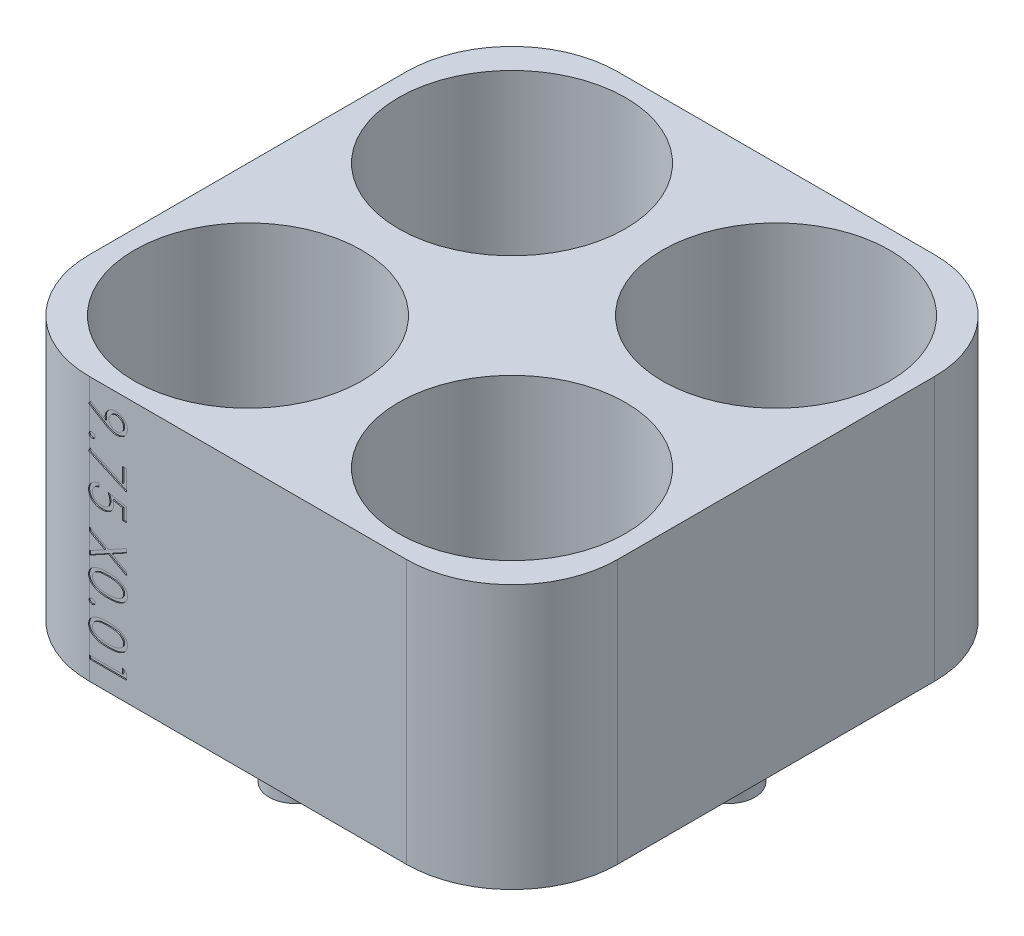
from build123d import *

# Parameters (mm, degrees)
CROQUIS1_W              = 50
CROQUIS1_H              = 50
SALIENTE_EXTRUIR1_DEPTH = 25
CROQUIS2_R              = 10.75
CORTAR_EXTRUIR1_DEPTH   = 34
MATRIZL1_COUNT          = 2
MATRIZL1_PITCH          = 25
MATRIZL1_COUNT_DIR2     = 2
MATRIZL1_PITCH_DIR2     = 25
CROQUIS3_R              = 2.5
SALIENTE_EXTRUIR2_DEPTH = 3
REDONDEO3_R             = 10
CORTAR_EXTRUIR3_DEPTH   = 0.3
CORTAR_EXTRUIR4_DEPTH   = 0.1


with BuildPart() as part:
    # Croquis1 → Saliente-Extruir1 (new body)
    with BuildSketch(Plane(origin=(0, 0, 0), x_dir=(1, 0, 0), z_dir=(0, 1, 0))):
        Rectangle(CROQUIS1_W, CROQUIS1_H)
    extrude(amount=SALIENTE_EXTRUIR1_DEPTH)

    # Croquis2 → Cortar-Extruir1 (cut)
    with BuildSketch(Plane(origin=(0, 25, 0), x_dir=(1, 0, 0), z_dir=(0, 1, 0))):
        with Locations((-12.5, 12.5)):
            Circle(CROQUIS2_R)
    cortar_extruir1 = extrude(amount=-CORTAR_EXTRUIR1_DEPTH, mode=Mode.SUBTRACT)

    # MatrizL1: Cortar-Extruir1 2 × 2
    with Locations(*[(i * MATRIZL1_PITCH, 0, j * MATRIZL1_PITCH_DIR2) for i in range(MATRIZL1_COUNT) for j in range(MATRIZL1_COUNT_DIR2) if (i, j) != (0, 0)]):
        add(cortar_extruir1, mode=Mode.SUBTRACT)

    # Croquis3 → Saliente-Extruir2 (add)
    with BuildSketch(Plane.XZ):
        Circle(CROQUIS3_R)
        with Locations((20.5, 0)):
            Circle(CROQUIS3_R)
        with Locations((-20.5, 0)):
            Circle(CROQUIS3_R)
        with Locations((0, 20.5)):
            Circle(CROQUIS3_R)
        with Locations((0, -20.5)):
            Circle(CROQUIS3_R)
    extrude(amount=SALIENTE_EXTRUIR2_DEPTH)

    # Redondeo3
    redondeo3_edges = [part.edges().sort_by_distance(p)[0] for p in [
        (-25, 12.5, -25),
        (25, 12.5, -25),
        (25, 12.5, 25),
        (-25, 12.5, 25),
    ]]
    fillet(redondeo3_edges, radius=REDONDEO3_R)

    # Croquis7 → Cortar-Extruir3 (cut)
    # profile 1 of 12: a face of its own
    with BuildSketch(Plane(origin=(0, 0, -25), x_dir=(-1, 0, 0), z_dir=(0, 0, -1))):
        with BuildLine():
            Line((7.86323481, 14.16830029), (8.484393234, 13.694695959))
            Line((8.484393234, 13.694695959), (9.149417792, 13.705076045))
            ThreePointArc((9.149417792, 13.705076045), (9.386308474, 13.714934795), (9.622367143, 13.737086445))
            ThreePointArc((9.622367143, 13.737086445), (9.785346207, 13.768816969), (9.94200435, 13.823837219))
            ThreePointArc((9.94200435, 13.823837219), (10.099622629, 13.904814199), (10.245594385, 14.005278319))
            ThreePointArc((10.245594385, 14.005278319), (10.465200323, 14.184267421), (10.678611888, 14.370598767))
            ThreePointArc((10.678611888, 14.370598767), (10.748834751, 14.437211884), (10.815736867, 14.50715947))
            ThreePointArc((10.815736867, 14.50715947), (10.875696904, 14.576852039), (10.931609178, 14.649832021))
            ThreePointArc((10.931609178, 14.649832021), (10.974783152, 14.713459238), (11.014169714, 14.779497965))
            ThreePointArc((11.014169714, 14.779497965), (11.031078423, 14.821656345), (11.036838147, 14.866712522))
            ThreePointArc((11.036838147, 14.866712522), (11.030990649, 14.911971737), (11.013832117, 14.95425855))
            ThreePointArc((11.013832117, 14.95425855), (10.973499954, 15.021137871), (10.929396147, 15.085592359))
            ThreePointArc((10.929396147, 15.085592359), (10.872271528, 15.159686265), (10.811089977, 15.230467243))
            ThreePointArc((10.811089977, 15.230467243), (10.742742286, 15.301718194), (10.671078147, 15.369632522))
            ThreePointArc((10.671078147, 15.369632522), (10.600249677, 15.435135159), (10.530965092, 15.502268711))
            ThreePointArc((10.530965092, 15.502268711), (10.470838971, 15.563883645), (10.412760147, 15.627432058))
            ThreePointArc((10.412760147, 15.627432058), (10.366750447, 15.680797919), (10.322099307, 15.735305563))
            ThreePointArc((10.322099307, 15.735305563), (10.309634741, 15.757837364), (10.305318147, 15.783222683))
            ThreePointArc((10.305318147, 15.783222683), (10.322977964, 15.817062163), (10.360836949, 15.821928047))
            ThreePointArc((10.360836949, 15.821928047), (10.464938475, 15.779174087), (10.565641792, 15.728935944))
            ThreePointArc((10.565641792, 15.728935944), (10.685479762, 15.658115338), (10.80015293, 15.579205504))
            ThreePointArc((10.80015293, 15.579205504), (10.895496521, 15.501041968), (10.982646048, 15.413835899))
            ThreePointArc((10.982646048, 15.413835899), (11.021361844, 15.375061817), (11.063691332, 15.340268761))
            ThreePointArc((11.063691332, 15.340268761), (11.112168535, 15.30717901), (11.16313288, 15.278065329))
            ThreePointArc((11.16313288, 15.278065329), (11.213198252, 15.254642568), (11.265031604, 15.235446974))
            ThreePointArc((11.265031604, 15.235446974), (11.308353468, 15.225078864), (11.352762249, 15.221594363))
            ThreePointArc((11.352762249, 15.221594363), (11.432778957, 15.21483446), (11.510527522, 15.19474639))
            ThreePointArc((11.510527522, 15.19474639), (11.581564368, 15.162282712), (11.645504209, 15.117429389))
            ThreePointArc((11.645504209, 15.117429389), (11.696555779, 15.064635334), (11.736235092, 15.002837056))
            ThreePointArc((11.736235092, 15.002837056), (11.760214617, 14.93793224), (11.768358147, 14.869220264))
            ThreePointArc((11.768358147, 14.869220264), (11.773882637, 14.831586132), (11.789989925, 14.797127414))
            ThreePointArc((11.789989925, 14.797127414), (11.834952775, 14.731856636), (11.882515317, 14.66845524))
            ThreePointArc((11.882515317, 14.66845524), (11.943740496, 14.593601157), (12.008164119, 14.521481442))
            ThreePointArc((12.008164119, 14.521481442), (12.081315107, 14.445694791), (12.156978147, 14.372415954))
            ThreePointArc((12.156978147, 14.372415954), (12.301025104, 14.230771784), (12.437977382, 14.082256901))
            ThreePointArc((12.437977382, 14.082256901), (12.458012124, 14.021175674), (12.427752835, 13.964459869))
            ThreePointArc((12.427752835, 13.964459869), (12.358977523, 13.938486362), (12.288144895, 13.95816898))
            ThreePointArc((12.288144895, 13.95816898), (12.116211023, 14.078225462), (11.949841766, 14.205881586))
            ThreePointArc((11.949841766, 14.205881586), (11.876853656, 14.261917644), (11.801451837, 14.314661079))
            ThreePointArc((11.801451837, 14.314661079), (11.725861585, 14.362479851), (11.648050447, 14.406592752))
            ThreePointArc((11.648050447, 14.406592752), (11.579899092, 14.440955957), (11.510142011, 14.471929924))
            ThreePointArc((11.510142011, 14.471929924), (11.465499719, 14.485494116), (11.419067588, 14.490074363))
            ThreePointArc((11.419067588, 14.490074363), (11.341606752, 14.476249366), (11.273710998, 14.436481562))
            ThreePointArc((11.273710998, 14.436481562), (11.144255452, 14.32108643), (11.019896144, 14.200216512))
            ThreePointArc((11.019896144, 14.200216512), (10.857872854, 14.028942281), (10.702974065, 13.851198719))
            ThreePointArc((10.702974065, 13.851198719), (10.507805241, 13.613314859), (10.317113267, 13.371827445))
            ThreePointArc((10.317113267, 13.371827445), (10.286178583, 13.322369213), (10.265700029, 13.267745957))
            ThreePointArc((10.265700029, 13.267745957), (10.244209839, 13.176834262), (10.227554828, 13.08491378))
            ThreePointArc((10.227554828, 13.08491378), (10.212396775, 12.968368546), (10.202724204, 12.851240414))
            ThreePointArc((10.202724204, 12.851240414), (10.196652192, 12.713930061), (10.194627649, 12.57650043))
            ThreePointArc((10.194627649, 12.57650043), (10.196974742, 12.407001146), (10.204014148, 12.237631837))
            ThreePointArc((10.204014148, 12.237631837), (10.215200557, 12.121142887), (10.235741268, 12.005934856))
            ThreePointArc((10.235741268, 12.005934856), (10.261858382, 11.911545635), (10.297843292, 11.820460428))
            ThreePointArc((10.297843292, 11.820460428), (10.345738461, 11.726684687), (10.401476176, 11.637347439))
            ThreePointArc((10.401476176, 11.637347439), (10.528164442, 11.461684596), (10.663203883, 11.292357395))
            ThreePointArc((10.663203883, 11.292357395), (10.809213276, 11.125907158), (10.962611178, 10.966240293))
            ThreePointArc((10.962611178, 10.966240293), (11.101492051, 10.833024694), (11.245125574, 10.70494775))
            ThreePointArc((11.245125574, 10.70494775), (11.314817945, 10.663878045), (11.394440327, 10.649594363))
            ThreePointArc((11.394440327, 10.649594363), (11.432403439, 10.654535966), (11.467836472, 10.669031398))
            ThreePointArc((11.467836472, 10.669031398), (11.530298415, 10.706475169), (11.591031755, 10.746662129))
            ThreePointArc((11.591031755, 10.746662129), (11.662143752, 10.798487213), (11.73080127, 10.853522662))
            ThreePointArc((11.73080127, 10.853522662), (11.801810134, 10.915474034), (11.870452278, 10.980037857))
            ThreePointArc((11.870452278, 10.980037857), (12.025461708, 11.125047444), (12.186538047, 11.26328679))
            ThreePointArc((12.186538047, 11.26328679), (12.254587835, 11.290007357), (12.325365272, 11.271695704))
            ThreePointArc((12.325365272, 11.271695704), (12.360505088, 11.219508638), (12.346156534, 11.158251674))
            ThreePointArc((12.346156534, 11.158251674), (12.220040997, 10.997339293), (12.086560751, 10.842481465))
            ThreePointArc((12.086560751, 10.842481465), (12.016855518, 10.762226569), (11.95034048, 10.679308431))
            ThreePointArc((11.95034048, 10.679308431), (11.889873706, 10.597140001), (11.833098581, 10.512378767))
            ThreePointArc((11.833098581, 10.512378767), (11.788334119, 10.438715394), (11.746856214, 10.363152619))
            ThreePointArc((11.746856214, 10.363152619), (11.728453997, 10.316861901), (11.719773423, 10.267809686))
            ThreePointArc((11.719773423, 10.267809686), (11.707668727, 10.198947202), (11.682064116, 10.13388593))
            ThreePointArc((11.682064116, 10.13388593), (11.64351294, 10.073656054), (11.594387786, 10.021689233))
            ThreePointArc((11.594387786, 10.021689233), (11.534949434, 9.978466356), (11.468682749, 9.946688042))
            ThreePointArc((11.468682749, 9.946688042), (11.396639148, 9.9267455), (11.322240766, 9.919474583))
            ThreePointArc((11.322240766, 9.919474583), (11.286133433, 9.914410259), (11.25249198, 9.900351828))
            ThreePointArc((11.25249198, 9.900351828), (11.187547122, 9.861253617), (11.124037342, 9.81986506))
            ThreePointArc((11.124037342, 9.81986506), (11.048996038, 9.766873755), (10.976073524, 9.711002631))
            ThreePointArc((10.976073524, 9.711002631), (10.899323235, 9.647838235), (10.824550677, 9.58234463))
            ThreePointArc((10.824550677, 9.58234463), (10.676176264, 9.455041131), (10.521481575, 9.335497413))
            ThreePointArc((10.521481575, 9.335497413), (10.461956669, 9.323518187), (10.414321119, 9.361168827))
            ThreePointArc((10.414321119, 9.361168827), (10.400671165, 9.436104359), (10.430044501, 9.506381399))
            ThreePointArc((10.430044501, 9.506381399), (10.564752999, 9.664275108), (10.706394652, 9.815980231))
            ThreePointArc((10.706394652, 9.815980231), (10.77061409, 9.883583462), (10.832948709, 9.952928456))
            ThreePointArc((10.832948709, 9.952928456), (10.887563949, 10.017750865), (10.93977038, 10.084528538))
            ThreePointArc((10.93977038, 10.084528538), (10.980684045, 10.140703557), (11.019807538, 10.198139721))
            ThreePointArc((11.019807538, 10.198139721), (11.032489007, 10.225311783), (11.036838147, 10.254980379))
            ThreePointArc((11.036838147, 10.254980379), (11.023135197, 10.323235085), (10.984149962, 10.380912005))
            ThreePointArc((10.984149962, 10.380912005), (10.738578212, 10.620957498), (10.490968322, 10.858900066))
            ThreePointArc((10.490968322, 10.858900066), (10.244458632, 11.091386657), (9.995592304, 11.321348813))
            ThreePointArc((9.995592304, 11.321348813), (9.924711735, 11.368661592), (9.842906067, 11.392544363))
            ThreePointArc((9.842906067, 11.392544363), (9.655466629, 11.412001774), (9.467225741, 11.420805266))
            ThreePointArc((9.467225741, 11.420805266), (9.206204699, 11.422735051), (8.945204291, 11.41892782))
            ThreePointArc((8.945204291, 11.41892782), (8.688312627, 11.410504285), (8.431568986, 11.398380521))
            ThreePointArc((8.431568986, 11.398380521), (8.340230633, 11.384113727), (8.253583038, 11.351889041))
            ThreePointArc((8.253583038, 11.351889041), (8.114518516, 11.272052208), (7.986888859, 11.17497733))
            ThreePointArc((7.986888859, 11.17497733), (7.796701335, 11.004093224), (7.612500855, 10.82677189))
            ThreePointArc((7.612500855, 10.82677189), (7.432971636, 10.643710566), (7.257728194, 10.456542394))
            ThreePointArc((7.257728194, 10.456542394), (7.212239352, 10.383288345), (7.196358147, 10.298534714))
            ThreePointArc((7.196358147, 10.298534714), (7.2009525, 10.260367585), (7.214472959, 10.224380989))
            ThreePointArc((7.214472959, 10.224380989), (7.24686407, 10.165753035), (7.282208785, 10.108856882))
            ThreePointArc((7.282208785, 10.108856882), (7.327836556, 10.043125429), (7.376737811, 9.979791516))
            ThreePointArc((7.376737811, 9.979791516), (7.431308227, 9.915603867), (7.488615657, 9.853847547))
            ThreePointArc((7.488615657, 9.853847547), (7.586446274, 9.759532651), (7.69044422, 9.672065193))
            ThreePointArc((7.69044422, 9.672065193), (7.768490778, 9.622876793), (7.854948437, 9.590692371))
            ThreePointArc((7.854948437, 9.590692371), (7.969762343, 9.567931888), (8.086432638, 9.558534294))
            ThreePointArc((8.086432638, 9.558534294), (8.37043584, 9.553668587), (8.654475657, 9.55197256))
            ThreePointArc((8.654475657, 9.55197256), (8.888026412, 9.54994276), (9.121511309, 9.544037031))
            ThreePointArc((9.121511309, 9.544037031), (9.26939093, 9.534580141), (9.416427255, 9.516191722))
            ThreePointArc((9.416427255, 9.516191722), (9.526066286, 9.493849289), (9.633167121, 9.461456195))
            ThreePointArc((9.633167121, 9.461456195), (9.732750872, 9.420298713), (9.82753738, 9.369050498))
            ThreePointArc((9.82753738, 9.369050498), (9.956450273, 9.276466249), (10.070011206, 9.165586622))
            ThreePointArc((10.070011206, 9.165586622), (10.154255352, 9.048207591), (10.213627052, 8.916488517))
            ThreePointArc((10.213627052, 8.916488517), (10.261377509, 8.736485332), (10.285519832, 8.551827809))
            ThreePointArc((10.285519832, 8.551827809), (10.300367247, 8.249157557), (10.305318147, 7.946163802))
            Line((10.305318147, 7.946163802), (10.305318147, 7.174874363))
            Line((10.305318147, 7.174874363), (10.030998147, 7.174874363))
            Line((10.030998147, 7.174874363), (9.756678147, 7.174874363))
            Line((9.756678147, 7.174874363), (9.756678147, 7.906394363))
            ThreePointArc((9.756678147, 7.906394363), (9.748192211, 8.215879743), (9.722760216, 8.524435128))
            ThreePointArc((9.722760216, 8.524435128), (9.679886207, 8.684546051), (9.591053515, 8.824483327))
            ThreePointArc((9.591053515, 8.824483327), (9.471610607, 8.919321671), (9.326219135, 8.965389441))
            ThreePointArc((9.326219135, 8.965389441), (9.07111708, 8.986254313), (8.815165929, 8.985067269))
            Line((8.815165929, 8.985067269), (8.247918147, 8.957954363))
            Line((8.247918147, 8.957954363), (8.221746921, 8.066414363))
            Line((8.221746921, 8.066414363), (8.195575696, 7.174874363))
            Line((8.195575696, 7.174874363), (7.924566921, 7.174874363))
            Line((7.924566921, 7.174874363), (7.653558147, 7.174874363))
            Line((7.653558147, 7.174874363), (7.653558147, 8.273443301))
            Line((7.653558147, 8.273443301), (7.653558147, 9.372012331))
            Line((7.653558147, 9.372012331), (7.356378147, 9.64236292))
            ThreePointArc((7.356378147, 9.64236292), (7.294048625, 9.695971686), (7.228832423, 9.746028814))
            ThreePointArc((7.228832423, 9.746028814), (7.16138397, 9.792011324), (7.091430747, 9.834085443))
            ThreePointArc((7.091430747, 9.834085443), (7.028567762, 9.867085285), (6.963859511, 9.896301493))
            ThreePointArc((6.963859511, 9.896301493), (6.918712844, 9.910238183), (6.871746147, 9.915393982))
            ThreePointArc((6.871746147, 9.915393982), (6.7910859, 9.923606521), (6.713072875, 9.945685677))
            ThreePointArc((6.713072875, 9.945685677), (6.643315449, 9.980347303), (6.581661068, 10.027952599))
            ThreePointArc((6.581661068, 10.027952599), (6.532164542, 10.085180748), (6.495290959, 10.151251209))
            ThreePointArc((6.495290959, 10.151251209), (6.472530746, 10.223480672), (6.464838147, 10.29881955))
            ThreePointArc((6.464838147, 10.29881955), (6.458907254, 10.342572282), (6.441542618, 10.383167189))
            ThreePointArc((6.441542618, 10.383167189), (6.397877347, 10.452240623), (6.350841819, 10.519064677))
            ThreePointArc((6.350841819, 10.519064677), (6.290002719, 10.596945165), (6.225339962, 10.671681329))
            ThreePointArc((6.225339962, 10.671681329), (6.152591882, 10.748410423), (6.076765507, 10.82209894))
            ThreePointArc((6.076765507, 10.82209894), (6.00352049, 10.892622988), (5.932545424, 10.965431049))
            ThreePointArc((5.932545424, 10.965431049), (5.875194126, 11.029425594), (5.821261024, 11.09632622))
            ThreePointArc((5.821261024, 11.09632622), (5.782785677, 11.14930283), (5.746922864, 11.204081768))
            ThreePointArc((5.746922864, 11.204081768), (5.741889711, 11.226566603), (5.751915854, 11.247312131))
            ThreePointArc((5.751915854, 11.247312131), (5.802055991, 11.273029006), (5.857781794, 11.264660859))
            ThreePointArc((5.857781794, 11.264660859), (5.996167998, 11.191907007), (6.130985952, 11.112736408))
            ThreePointArc((6.130985952, 11.112736408), (6.263942541, 11.02509534), (6.391723363, 10.930066537))
            ThreePointArc((6.391723363, 10.930066537), (6.454965216, 10.864698545), (6.498615351, 10.784903983))
            ThreePointArc((6.498615351, 10.784903983), (6.539576747, 10.720537596), (6.602398928, 10.677245087))
            ThreePointArc((6.602398928, 10.677245087), (6.680774626, 10.658791835), (6.76078517, 10.667824298))
            ThreePointArc((6.76078517, 10.667824298), (6.870383567, 10.711443901), (6.969830451, 10.774885176))
            ThreePointArc((6.969830451, 10.774885176), (7.093611904, 10.87917138), (7.209177303, 10.992494363))
            ThreePointArc((7.209177303, 10.992494363), (7.40987093, 11.212651518), (7.602386037, 11.439994956))
            ThreePointArc((7.602386037, 11.439994956), (7.716329513, 11.598522582), (7.810081024, 11.769767373))
            ThreePointArc((7.810081024, 11.769767373), (7.875045709, 11.93778874), (7.915646584, 12.113297028))
            ThreePointArc((7.915646584, 12.113297028), (7.945843333, 12.351677244), (7.961438547, 12.591455808))
            ThreePointArc((7.961438547, 12.591455808), (7.965776624, 12.780547184), (7.9657707, 12.969688315))
            ThreePointArc((7.9657707, 12.969688315), (7.959012671, 13.083491143), (7.941423062, 13.196129326))
            ThreePointArc((7.941423062, 13.196129326), (7.916094906, 13.288096933), (7.878876639, 13.375928346))
            ThreePointArc((7.878876639, 13.375928346), (7.822667555, 13.477991059), (7.759151961, 13.575674363))
            ThreePointArc((7.759151961, 13.575674363), (7.622589312, 13.762081769), (7.478977333, 13.943114024))
            ThreePointArc((7.478977333, 13.943114024), (7.347552962, 14.093088855), (7.207443144, 14.234983372))
            ThreePointArc((7.207443144, 14.234983372), (7.090713724, 14.339284353), (6.967408114, 14.435721787))
            ThreePointArc((6.967408114, 14.435721787), (6.888468536, 14.47614238), (6.800883256, 14.490074363))
            ThreePointArc((6.800883256, 14.490074363), (6.753885332, 14.484769401), (6.709252512, 14.469121435))
            ThreePointArc((6.709252512, 14.469121435), (6.637114047, 14.43206349), (6.566913625, 14.391453762))
            ThreePointArc((6.566913625, 14.391453762), (6.486007966, 14.33912434), (6.407787725, 14.282859893))
            ThreePointArc((6.407787725, 14.282859893), (6.328780658, 14.22027952), (6.252550677, 14.15434463))
            ThreePointArc((6.252550677, 14.15434463), (6.104176264, 14.027041131), (5.949481575, 13.907497413))
            ThreePointArc((5.949481575, 13.907497413), (5.889956669, 13.895518187), (5.842321119, 13.933168827))
            ThreePointArc((5.842321119, 13.933168827), (5.828671165, 14.008104359), (5.858044501, 14.078381399))
            ThreePointArc((5.858044501, 14.078381399), (5.992752999, 14.236275108), (6.134394652, 14.387980231))
            ThreePointArc((6.134394652, 14.387980231), (6.198961083, 14.456629975), (6.260909665, 14.527650991))
            ThreePointArc((6.260909665, 14.527650991), (6.315948055, 14.596336568), (6.36777038, 14.667479941))
            ThreePointArc((6.36777038, 14.667479941), (6.407953909, 14.728248662), (6.445387304, 14.790749017))
            ThreePointArc((6.445387304, 14.790749017), (6.459893185, 14.826240513), (6.464838147, 14.864261747))
            ThreePointArc((6.464838147, 14.864261747), (6.472677106, 14.932825289), (6.495789489, 14.997850101))
            ThreePointArc((6.495789489, 14.997850101), (6.534135071, 15.060305374), (6.583615964, 15.114367247))
            ThreePointArc((6.583615964, 15.114367247), (6.64448395, 15.160001587), (6.712606897, 15.193864085))
            ThreePointArc((6.712606897, 15.193864085), (6.785347973, 15.214602013), (6.860663527, 15.221594363))
            ThreePointArc((6.860663527, 15.221594363), (6.907100873, 15.226714946), (6.951306811, 15.241830583))
            ThreePointArc((6.951306811, 15.241830583), (7.021249567, 15.276934025), (7.089284193, 15.315606113))
            ThreePointArc((7.089284193, 15.315606113), (7.167315135, 15.365417761), (7.242714295, 15.419129909))
            ThreePointArc((7.242714295, 15.419129909), (7.318379889, 15.478704618), (7.391278966, 15.541634363))
            ThreePointArc((7.391278966, 15.541634363), (7.51469326, 15.651797267), (7.639417316, 15.760475063))
            ThreePointArc((7.639417316, 15.760475063), (7.694761968, 15.802705508), (7.754691518, 15.838129934))
            ThreePointArc((7.754691518, 15.838129934), (7.783412053, 15.843097109), (7.80983232, 15.830788113))
            ThreePointArc((7.80983232, 15.830788113), (7.829491006, 15.803447729), (7.836438147, 15.770497801))
            ThreePointArc((7.836438147, 15.770497801), (7.832421069, 15.742729485), (7.82069922, 15.717238025))
            ThreePointArc((7.82069922, 15.717238025), (7.78121984, 15.657930363), (7.740253782, 15.599639693))
            ThreePointArc((7.740253782, 15.599639693), (7.688417599, 15.530163842), (7.634417012, 15.462356614))
            ThreePointArc((7.634417012, 15.462356614), (7.572553478, 15.388894837), (7.509001931, 15.316888376))
            ThreePointArc((7.509001931, 15.316888376), (7.445629332, 15.243258891), (7.385868918, 15.166668549))
            ThreePointArc((7.385868918, 15.166668549), (7.334010604, 15.092308815), (7.286637773, 15.015014121))
            ThreePointArc((7.286637773, 15.015014121), (7.251515075, 14.949140803), (7.220463925, 14.88125322))
            ThreePointArc((7.220463925, 14.88125322), (7.209973585, 14.840358156), (7.211821931, 14.798179523))
            ThreePointArc((7.211821931, 14.798179523), (7.227423244, 14.75262655), (7.254905076, 14.713088933))
            ThreePointArc((7.254905076, 14.713088933), (7.334128122, 14.629762133), (7.415655407, 14.548688409))
            ThreePointArc((7.415655407, 14.548688409), (7.517822687, 14.453154516), (7.623129749, 14.361093122))
            ThreePointArc((7.623129749, 14.361093122), (7.741971738, 14.263189092), (7.86323481, 14.16830029))
        make_face()
        with BuildLine():
            ThreePointArc((6.739158147, 14.855834363), (6.740920439, 14.838040196), (6.746138859, 14.820937384))
            ThreePointArc((6.746138859, 14.820937384), (6.754625126, 14.805122561), (6.766018647, 14.791254863))
            ThreePointArc((6.766018647, 14.791254863), (6.779886344, 14.779861342), (6.795701168, 14.771375075))
            ThreePointArc((6.795701168, 14.771375075), (6.812803979, 14.766156656), (6.830598147, 14.764394363))
            ThreePointArc((6.830598147, 14.764394363), (6.848392314, 14.766156656), (6.865495125, 14.771375075))
            ThreePointArc((6.865495125, 14.771375075), (6.881309949, 14.779861342), (6.895177647, 14.791254863))
            ThreePointArc((6.895177647, 14.791254863), (6.906571168, 14.805122561), (6.915057434, 14.820937384))
            ThreePointArc((6.915057434, 14.820937384), (6.920275854, 14.838040196), (6.922038147, 14.855834363))
            ThreePointArc((6.922038147, 14.855834363), (6.920275854, 14.87362853), (6.915057434, 14.890731341))
            ThreePointArc((6.915057434, 14.890731341), (6.906571168, 14.906546165), (6.895177647, 14.920413863))
            ThreePointArc((6.895177647, 14.920413863), (6.881309949, 14.931807384), (6.865495125, 14.94029365))
            ThreePointArc((6.865495125, 14.94029365), (6.848392314, 14.94551207), (6.830598147, 14.947274363))
            ThreePointArc((6.830598147, 14.947274363), (6.812803979, 14.94551207), (6.795701168, 14.94029365))
            ThreePointArc((6.795701168, 14.94029365), (6.779886344, 14.931807384), (6.766018647, 14.920413863))
            ThreePointArc((6.766018647, 14.920413863), (6.754627038, 14.90654902), (6.746141503, 14.890737686))
            ThreePointArc((6.746141503, 14.890737686), (6.740921114, 14.8736319), (6.739158147, 14.855834363))
        make_face(mode=Mode.SUBTRACT)
        with BuildLine():
            ThreePointArc((11.311158147, 14.855834363), (11.312920439, 14.838040196), (11.318138859, 14.820937384))
            ThreePointArc((11.318138859, 14.820937384), (11.326625126, 14.805122561), (11.338018647, 14.791254863))
            ThreePointArc((11.338018647, 14.791254863), (11.351886344, 14.779861342), (11.367701168, 14.771375075))
            ThreePointArc((11.367701168, 14.771375075), (11.384803979, 14.766156656), (11.402598147, 14.764394363))
            ThreePointArc((11.402598147, 14.764394363), (11.420392314, 14.766156656), (11.437495125, 14.771375075))
            ThreePointArc((11.437495125, 14.771375075), (11.453309949, 14.779861342), (11.467177647, 14.791254863))
            ThreePointArc((11.467177647, 14.791254863), (11.478571168, 14.805122561), (11.487057434, 14.820937384))
            ThreePointArc((11.487057434, 14.820937384), (11.492275854, 14.838040196), (11.494038147, 14.855834363))
            ThreePointArc((11.494038147, 14.855834363), (11.492275854, 14.87362853), (11.487057434, 14.890731341))
            ThreePointArc((11.487057434, 14.890731341), (11.478571168, 14.906546165), (11.467177647, 14.920413863))
            ThreePointArc((11.467177647, 14.920413863), (11.453309949, 14.931807384), (11.437495125, 14.94029365))
            ThreePointArc((11.437495125, 14.94029365), (11.420392314, 14.94551207), (11.402598147, 14.947274363))
            ThreePointArc((11.402598147, 14.947274363), (11.384803979, 14.94551207), (11.367701168, 14.94029365))
            ThreePointArc((11.367701168, 14.94029365), (11.351886344, 14.931807384), (11.338018647, 14.920413863))
            ThreePointArc((11.338018647, 14.920413863), (11.326627038, 14.90654902), (11.318141503, 14.890737686))
            ThreePointArc((11.318141503, 14.890737686), (11.312921114, 14.8736319), (11.311158147, 14.855834363))
        make_face(mode=Mode.SUBTRACT)
    # profile 2 of 12: a face of its own
    with BuildSketch(Plane(origin=(0, 0, -25), x_dir=(-1, 0, 0), z_dir=(0, 0, -1))):
        with BuildLine():
            Line((-2.705799325, 14.087153792), (-2.346749747, 13.679251925))
            Line((-2.346749747, 13.679251925), (-1.664489636, 14.336123083))
            ThreePointArc((-1.664489636, 14.336123083), (-1.340372545, 14.632751979), (-1.001669176, 14.91261019))
            ThreePointArc((-1.001669176, 14.91261019), (-0.721242038, 15.109767589), (-0.421703569, 15.276462295))
            ThreePointArc((-0.421703569, 15.276462295), (-0.140136343, 15.393298546), (0.153722864, 15.474400817))
            ThreePointArc((0.153722864, 15.474400817), (0.472909584, 15.524313704), (0.795558147, 15.540725998))
            ThreePointArc((0.795558147, 15.540725998), (0.990219794, 15.5377115), (1.184718008, 15.529185721))
            ThreePointArc((1.184718008, 15.529185721), (1.316942814, 15.5158517), (1.447556436, 15.49133075))
            ThreePointArc((1.447556436, 15.49133075), (1.567567804, 15.457381196), (1.683811336, 15.412184492))
            ThreePointArc((1.683811336, 15.412184492), (1.832058458, 15.342432757), (1.977187523, 15.266405998))
            ThreePointArc((1.977187523, 15.266405998), (2.184901896, 15.137986903), (2.378818978, 14.989552104))
            ThreePointArc((2.378818978, 14.989552104), (2.577922268, 14.807696482), (2.763019134, 14.611602786))
            ThreePointArc((2.763019134, 14.611602786), (2.929305395, 14.406787508), (3.079746537, 14.190066764))
            ThreePointArc((3.079746537, 14.190066764), (3.190494769, 13.992217716), (3.277211949, 13.782719394))
            ThreePointArc((3.277211949, 13.782719394), (3.30365962, 13.695663266), (3.323316088, 13.606827056))
            ThreePointArc((3.323316088, 13.606827056), (3.344541183, 13.479486359), (3.362191073, 13.3516011))
            ThreePointArc((3.362191073, 13.3516011), (3.37769774, 13.210355874), (3.389302576, 13.068736672))
            ThreePointArc((3.389302576, 13.068736672), (3.396329664, 12.93366333), (3.399034078, 12.798434363))
            ThreePointArc((3.399034078, 12.798434363), (3.375351391, 12.417246641), (3.301663645, 12.042499974))
            ThreePointArc((3.301663645, 12.042499974), (3.181276739, 11.697005105), (3.010560016, 11.373407342))
            ThreePointArc((3.010560016, 11.373407342), (2.789877881, 11.073191381), (2.527681104, 10.808459293))
            ThreePointArc((2.527681104, 10.808459293), (2.210910601, 10.56383075), (1.867435749, 10.358375885))
            ThreePointArc((1.867435749, 10.358375885), (1.757665909, 10.306007761), (1.644531547, 10.261370847))
            ThreePointArc((1.644531547, 10.261370847), (1.532011469, 10.226185529), (1.417141572, 10.199658539))
            ThreePointArc((1.417141572, 10.199658539), (1.2835302, 10.178443387), (1.14885012, 10.165662245))
            ThreePointArc((1.14885012, 10.165662245), (0.97229159, 10.157029382), (0.795558147, 10.153461314))
            ThreePointArc((0.795558147, 10.153461314), (0.47078588, 10.168435363), (0.149315731, 10.216996569))
            ThreePointArc((0.149315731, 10.216996569), (-0.144993135, 10.296781441), (-0.426970879, 10.412849893))
            ThreePointArc((-0.426970879, 10.412849893), (-0.724075437, 10.577964032), (-1.001698437, 10.774074378))
            ThreePointArc((-1.001698437, 10.774074378), (-1.333202357, 11.05076727), (-1.649501356, 11.344720921))
            Line((-1.649501356, 11.344720921), (-2.311972829, 11.994123825))
            Line((-2.311972829, 11.994123825), (-2.98104074, 11.344721301))
            ThreePointArc((-2.98104074, 11.344721301), (-3.2994389, 11.051332512), (-3.632624107, 10.774851069))
            ThreePointArc((-3.632624107, 10.774851069), (-3.910329122, 10.579202856), (-4.207162932, 10.414012096))
            ThreePointArc((-4.207162932, 10.414012096), (-4.487778328, 10.297754944), (-4.780633739, 10.217154486))
            ThreePointArc((-4.780633739, 10.217154486), (-5.099780281, 10.167353367), (-5.422361853, 10.150746277))
            ThreePointArc((-5.422361853, 10.150746277), (-5.683210183, 10.15996733), (-5.942769662, 10.18745834))
            ThreePointArc((-5.942769662, 10.18745834), (-6.159754494, 10.230965026), (-6.370345388, 10.298985056))
            ThreePointArc((-6.370345388, 10.298985056), (-6.575177721, 10.391840457), (-6.768365054, 10.506979784))
            ThreePointArc((-6.768365054, 10.506979784), (-6.989082303, 10.666285334), (-7.199234083, 10.839289935))
            ThreePointArc((-7.199234083, 10.839289935), (-7.435919474, 11.085308822), (-7.628023584, 11.367516686))
            ThreePointArc((-7.628023584, 11.367516686), (-7.799462402, 11.716750863), (-7.929966785, 12.083253776))
            ThreePointArc((-7.929966785, 12.083253776), (-8.018510626, 12.464652856), (-8.063221382, 12.853633856))
            ThreePointArc((-8.063221382, 12.853633856), (-8.055261199, 13.201874698), (-7.99160722, 13.544341075))
            ThreePointArc((-7.99160722, 13.544341075), (-7.88146403, 13.858258165), (-7.726695665, 14.152744522))
            ThreePointArc((-7.726695665, 14.152744522), (-7.513519924, 14.458121778), (-7.269606399, 14.739556241))
            ThreePointArc((-7.269606399, 14.739556241), (-6.999851735, 14.991709672), (-6.705075955, 15.214097106))
            ThreePointArc((-6.705075955, 15.214097106), (-6.42348408, 15.373745015), (-6.120532771, 15.487771082))
            ThreePointArc((-6.120532771, 15.487771082), (-5.945253309, 15.530488712), (-5.76695011, 15.557977891))
            ThreePointArc((-5.76695011, 15.557977891), (-5.574972509, 15.572302493), (-5.382462466, 15.572993162))
            ThreePointArc((-5.382462466, 15.572993162), (-5.187162087, 15.559932697), (-4.993248972, 15.533277165))
            ThreePointArc((-4.993248972, 15.533277165), (-4.807569909, 15.49374198), (-4.625457407, 15.44012499))
            ThreePointArc((-4.625457407, 15.44012499), (-4.394487843, 15.349595629), (-4.173474242, 15.236921353))
            ThreePointArc((-4.173474242, 15.236921353), (-3.900498529, 15.071879199), (-3.635536014, 14.894257359))
            ThreePointArc((-3.635536014, 14.894257359), (-3.369865663, 14.697628998), (-3.113605638, 14.488884545))
            ThreePointArc((-3.113605638, 14.488884545), (-2.902557137, 14.295272576), (-2.705799325, 14.087153792))
        make_face()
        with BuildLine():
            Line((0.882744496, 14.633629533), (0.762928697, 14.666152598))
            ThreePointArc((0.762928697, 14.666152598), (0.75910369, 14.665971744), (0.756101695, 14.663594473))
            ThreePointArc((0.756101695, 14.663594473), (0.753191606, 14.660589878), (0.749410756, 14.658800639))
            ThreePointArc((0.749410756, 14.658800639), (0.708006752, 14.647722095), (0.66658349, 14.636715776))
            ThreePointArc((0.66658349, 14.636715776), (0.619163818, 14.624355438), (0.571650468, 14.612360236))
            ThreePointArc((0.571650468, 14.612360236), (0.515935139, 14.598664265), (0.460154581, 14.585236428))
            ThreePointArc((0.460154581, 14.585236428), (0.390108823, 14.566173664), (0.321420258, 14.54268583))
            ThreePointArc((0.321420258, 14.54268583), (0.229825407, 14.50668615), (0.139206399, 14.468296189))
            ThreePointArc((0.139206399, 14.468296189), (0.042637264, 14.42438658), (-0.05276548, 14.377997269))
            ThreePointArc((-0.05276548, 14.377997269), (-0.139965622, 14.332413676), (-0.225645419, 14.284032885))
            ThreePointArc((-0.225645419, 14.284032885), (-0.427006806, 14.152495655), (-0.614702045, 14.002099682))
            ThreePointArc((-0.614702045, 14.002099682), (-0.871131018, 13.767627669), (-1.119564505, 13.52470022))
            ThreePointArc((-1.119564505, 13.52470022), (-1.359697765, 13.276750347), (-1.594587347, 13.023827423))
            ThreePointArc((-1.594587347, 13.023827423), (-1.652953902, 12.929369847), (-1.673323405, 12.820218706))
            ThreePointArc((-1.673323405, 12.820218706), (-1.647435931, 12.691732851), (-1.573812911, 12.583296569))
            ThreePointArc((-1.573812911, 12.583296569), (-1.283091097, 12.30480791), (-0.985983098, 12.03314278))
            ThreePointArc((-0.985983098, 12.03314278), (-0.679675018, 11.769294558), (-0.364057779, 11.516655919))
            ThreePointArc((-0.364057779, 11.516655919), (-0.14056717, 11.36373108), (0.098847071, 11.237181171))
            ThreePointArc((0.098847071, 11.237181171), (0.363608868, 11.137493159), (0.639595708, 11.075301739))
            ThreePointArc((0.639595708, 11.075301739), (0.89300828, 11.06086948), (1.144551162, 11.094816498))
            ThreePointArc((1.144551162, 11.094816498), (1.389970918, 11.176848012), (1.616009584, 11.302810494))
            ThreePointArc((1.616009584, 11.302810494), (1.849381242, 11.485262575), (2.058295172, 11.695277009))
            ThreePointArc((2.058295172, 11.695277009), (2.30446923, 12.058995177), (2.452567261, 12.472467723))
            ThreePointArc((2.452567261, 12.472467723), (2.492704199, 12.908521951), (2.42230437, 13.340723441))
            ThreePointArc((2.42230437, 13.340723441), (2.245340457, 13.743664604), (1.973687477, 14.089905077))
            ThreePointArc((1.973687477, 14.089905077), (1.622407288, 14.36086322), (1.215794078, 14.538294285))
            ThreePointArc((1.215794078, 14.538294285), (1.128695237, 14.563958077), (1.041487858, 14.589250596))
            ThreePointArc((1.041487858, 14.589250596), (0.96219993, 14.611739647), (0.882744496, 14.633629533))
        make_face(mode=Mode.SUBTRACT)
        with BuildLine():
            ThreePointArc((-5.867958117, 14.532370758), (-6.044785384, 14.467822949), (-6.213296456, 14.38392825))
            ThreePointArc((-6.213296456, 14.38392825), (-6.374351874, 14.280443573), (-6.523502724, 14.160435449))
            ThreePointArc((-6.523502724, 14.160435449), (-6.661796493, 14.022833579), (-6.785019296, 13.871586821))
            ThreePointArc((-6.785019296, 13.871586821), (-6.894150709, 13.705755991), (-6.986364141, 13.529954363))
            ThreePointArc((-6.986364141, 13.529954363), (-7.078276514, 13.28445653), (-7.132284367, 13.02794099))
            ThreePointArc((-7.132284367, 13.02794099), (-7.144059604, 12.776764706), (-7.11301805, 12.527235941))
            ThreePointArc((-7.11301805, 12.527235941), (-7.038525653, 12.278292918), (-6.924536527, 12.044780122))
            ThreePointArc((-6.924536527, 12.044780122), (-6.764336835, 11.809712292), (-6.57612361, 11.596412952))
            ThreePointArc((-6.57612361, 11.596412952), (-6.267676209, 11.343071001), (-5.915881181, 11.15449157))
            ThreePointArc((-5.915881181, 11.15449157), (-5.573785808, 11.065467358), (-5.22040564, 11.074243003))
            ThreePointArc((-5.22040564, 11.074243003), (-4.820165418, 11.185883343), (-4.452952189, 11.380331911))
            ThreePointArc((-4.452952189, 11.380331911), (-3.996325271, 11.718752158), (-3.570701853, 12.095423252))
            ThreePointArc((-3.570701853, 12.095423252), (-3.451365919, 12.212786724), (-3.334228138, 12.3323442))
            ThreePointArc((-3.334228138, 12.3323442), (-3.233044933, 12.440410892), (-3.134790183, 12.551146861))
            ThreePointArc((-3.134790183, 12.551146861), (-3.055808103, 12.644291358), (-2.978526629, 12.738851602))
            ThreePointArc((-2.978526629, 12.738851602), (-2.959925411, 12.772334068), (-2.953481853, 12.810090677))
            ThreePointArc((-2.953481853, 12.810090677), (-2.975671282, 12.927827106), (-3.039195058, 13.029409425))
            ThreePointArc((-3.039195058, 13.029409425), (-3.289274497, 13.294531567), (-3.545167965, 13.554046517))
            ThreePointArc((-3.545167965, 13.554046517), (-3.808754122, 13.806696356), (-4.08083839, 14.050170696))
            ThreePointArc((-4.08083839, 14.050170696), (-4.272172066, 14.197739666), (-4.478765518, 14.323056551))
            ThreePointArc((-4.478765518, 14.323056551), (-4.676302935, 14.421480132), (-4.878888762, 14.509042768))
            ThreePointArc((-4.878888762, 14.509042768), (-5.040630863, 14.563184156), (-5.20753985, 14.598300918))
            ThreePointArc((-5.20753985, 14.598300918), (-5.363814925, 14.611452546), (-5.520467622, 14.604050045))
            ThreePointArc((-5.520467622, 14.604050045), (-5.695837797, 14.576087805), (-5.867958117, 14.532370758))
        make_face(mode=Mode.SUBTRACT)
    # profile 3 of 12: a face of its own
    with BuildSketch(Plane(origin=(0, 0, -25), x_dir=(-1, 0, 0), z_dir=(0, 0, -1))):
        with BuildLine():
            Line((-9.449879789, 8.729354363), (-8.805641853, 8.729354363))
            Line((-8.805641853, 8.729354363), (-8.805641853, 8.455034363))
            Line((-8.805641853, 8.455034363), (-8.805641853, 8.180714363))
            Line((-8.805641853, 8.180714363), (-9.406361597, 8.180714363))
            ThreePointArc((-9.406361597, 8.180714363), (-9.594247509, 8.179597168), (-9.782106845, 8.176245416))
            ThreePointArc((-9.782106845, 8.176245416), (-9.850325852, 8.169109161), (-9.916520719, 8.151136997))
            ThreePointArc((-9.916520719, 8.151136997), (-9.951525387, 8.127742237), (-9.971504871, 8.09068199))
            ThreePointArc((-9.971504871, 8.09068199), (-9.980370032, 8.033140597), (-9.977861597, 7.974974363))
            ThreePointArc((-9.977861597, 7.974974363), (-9.962494187, 7.915549116), (-9.934312931, 7.861020829))
            ThreePointArc((-9.934312931, 7.861020829), (-9.89791743, 7.823063728), (-9.85069416, 7.799926382))
            ThreePointArc((-9.85069416, 7.799926382), (-9.767662294, 7.78170012), (-9.68298177, 7.774237137))
            ThreePointArc((-9.68298177, 7.774237137), (-9.472935724, 7.770485101), (-9.262859893, 7.769234363))
            Line((-9.262859893, 7.769234363), (-8.577041853, 7.769234363))
            Line((-8.577041853, 7.769234363), (-8.577041853, 8.363594363))
            Line((-8.577041853, 8.363594363), (-8.577041853, 8.957954363))
            Line((-8.577041853, 8.957954363), (-9.285701853, 8.984660695))
            Line((-9.285701853, 8.984660695), (-9.994361853, 9.011367119))
            Line((-9.994361853, 9.011367119), (-9.994361853, 9.281840695))
            Line((-9.994361853, 9.281840695), (-9.994361853, 9.552314363))
            Line((-9.994361853, 9.552314363), (-9.304023955, 9.552314363))
            ThreePointArc((-9.304023955, 9.552314363), (-9.151991991, 9.550090569), (-9.000090111, 9.543421091))
            ThreePointArc((-9.000090111, 9.543421091), (-8.864456734, 9.532698917), (-8.729373029, 9.516457904))
            ThreePointArc((-8.729373029, 9.516457904), (-8.617323193, 9.498037976), (-8.506233914, 9.474508598))
            ThreePointArc((-8.506233914, 9.474508598), (-8.428887071, 9.451172367), (-8.354981734, 9.418536271))
            ThreePointArc((-8.354981734, 9.418536271), (-8.248891935, 9.354107547), (-8.152598862, 9.275789287))
            ThreePointArc((-8.152598862, 9.275789287), (-8.08766015, 9.197958026), (-8.043834274, 9.106557622))
            ThreePointArc((-8.043834274, 9.106557622), (-8.009830389, 8.975164388), (-7.994427778, 8.840319272))
            ThreePointArc((-7.994427778, 8.840319272), (-7.985618712, 8.573343886), (-7.982681853, 8.306239354))
            ThreePointArc((-7.982681853, 8.306239354), (-7.984592975, 8.110338822), (-7.99032578, 7.914512863))
            ThreePointArc((-7.99032578, 7.914512863), (-8.000016004, 7.807034658), (-8.020577607, 7.701097481))
            ThreePointArc((-8.020577607, 7.701097481), (-8.04711551, 7.622378517), (-8.086230521, 7.54909174))
            ThreePointArc((-8.086230521, 7.54909174), (-8.142694301, 7.470989285), (-8.207125448, 7.399317958))
            ThreePointArc((-8.207125448, 7.399317958), (-8.281983553, 7.332705884), (-8.364073796, 7.275242016))
            ThreePointArc((-8.364073796, 7.275242016), (-8.442611624, 7.235667855), (-8.526751408, 7.210078763))
            ThreePointArc((-8.526751408, 7.210078763), (-8.646757042, 7.19024871), (-8.768071992, 7.181458591))
            ThreePointArc((-8.768071992, 7.181458591), (-9.015435017, 7.176520378), (-9.262841853, 7.174874363))
            ThreePointArc((-9.262841853, 7.174874363), (-9.51024869, 7.176520378), (-9.757611715, 7.181458591))
            ThreePointArc((-9.757611715, 7.181458591), (-9.878926665, 7.19024871), (-9.998932299, 7.210078763))
            ThreePointArc((-9.998932299, 7.210078763), (-10.083072082, 7.235667855), (-10.161609911, 7.275242016))
            ThreePointArc((-10.161609911, 7.275242016), (-10.243700154, 7.332705884), (-10.318558258, 7.399317958))
            ThreePointArc((-10.318558258, 7.399317958), (-10.371562499, 7.457312812), (-10.419148385, 7.5198303))
            ThreePointArc((-10.419148385, 7.5198303), (-10.457569882, 7.58240197), (-10.488890222, 7.648813278))
            ThreePointArc((-10.488890222, 7.648813278), (-10.513026959, 7.718961725), (-10.529419996, 7.791312642))
            ThreePointArc((-10.529419996, 7.791312642), (-10.539600384, 7.871427217), (-10.543001853, 7.952114363))
            ThreePointArc((-10.543001853, 7.952114363), (-10.539600384, 8.032801508), (-10.529419996, 8.112916083))
            ThreePointArc((-10.529419996, 8.112916083), (-10.513026959, 8.185267), (-10.488890222, 8.255415448))
            ThreePointArc((-10.488890222, 8.255415448), (-10.457569882, 8.321826755), (-10.419148385, 8.384398426))
            ThreePointArc((-10.419148385, 8.384398426), (-10.371562499, 8.446915913), (-10.318558258, 8.504910768))
            ThreePointArc((-10.318558258, 8.504910768), (-10.247829114, 8.568654167), (-10.170875709, 8.624725606))
            ThreePointArc((-10.170875709, 8.624725606), (-10.098901139, 8.663723853), (-10.021566168, 8.690566063))
            ThreePointArc((-10.021566168, 8.690566063), (-9.919322558, 8.711352579), (-9.815467997, 8.721355832))
            ThreePointArc((-9.815467997, 8.721355832), (-9.632717637, 8.727354491), (-9.449879789, 8.729354363))
        make_face()
    # profile 4 of 12: a face of its own
    with BuildSketch(Plane(origin=(0, 0, -25), x_dir=(-1, 0, 0), z_dir=(0, 0, -1))):
        with BuildLine():
            Line((-5.422361853, 9.281840695), (-5.422361853, 9.011367119))
            Line((-5.422361853, 9.011367119), (-6.131021854, 8.984660695))
            Line((-6.131021854, 8.984660695), (-6.839681853, 8.957954363))
            Line((-6.839681853, 8.957954363), (-6.865853079, 8.066414363))
            Line((-6.865853079, 8.066414363), (-6.892024304, 7.174874363))
            Line((-6.892024304, 7.174874363), (-7.163033079, 7.174874363))
            Line((-7.163033079, 7.174874363), (-7.434041853, 7.174874363))
            Line((-7.434041853, 7.174874363), (-7.434041853, 8.174097723))
            ThreePointArc((-7.434041853, 8.174097723), (-7.432726055, 8.492471747), (-7.42877875, 8.810824019))
            ThreePointArc((-7.42877875, 8.810824019), (-7.420851191, 8.937722318), (-7.401333948, 9.063361091))
            ThreePointArc((-7.401333948, 9.063361091), (-7.37536816, 9.144848189), (-7.332466461, 9.218833414))
            ThreePointArc((-7.332466461, 9.218833414), (-7.267659793, 9.295530993), (-7.193110346, 9.362797648))
            ThreePointArc((-7.193110346, 9.362797648), (-7.115994541, 9.416238929), (-7.032991591, 9.459980537))
            ThreePointArc((-7.032991591, 9.459980537), (-6.944887807, 9.493640199), (-6.853408003, 9.516590035))
            ThreePointArc((-6.853408003, 9.516590035), (-6.728479543, 9.535326066), (-6.602500849, 9.544681683))
            ThreePointArc((-6.602500849, 9.544681683), (-6.394919332, 9.550406032), (-6.187267669, 9.552314363))
            Line((-6.187267669, 9.552314363), (-5.422361853, 9.552314363))
            Line((-5.422361853, 9.552314363), (-5.422361853, 9.281840695))
        make_face()
    # profile 5 of 12: a face of its own
    with BuildSketch(Plane(origin=(0, 0, -25), x_dir=(-1, 0, 0), z_dir=(0, 0, -1))):
        with BuildLine():
            Line((-2.953481853, 9.277994363), (-2.953481853, 9.003674363))
            Line((-2.953481853, 9.003674363), (-3.620993853, 9.003674363))
            ThreePointArc((-3.620993853, 9.003674363), (-3.759847663, 9.001808716), (-3.898601213, 8.996212859))
            ThreePointArc((-3.898601213, 8.996212859), (-4.016596637, 8.987302673), (-4.134096429, 8.973298726))
            ThreePointArc((-4.134096429, 8.973298726), (-4.225730506, 8.958295606), (-4.316614509, 8.939269422))
            ThreePointArc((-4.316614509, 8.939269422), (-4.360600308, 8.922327572), (-4.398233853, 8.893946363))
            ThreePointArc((-4.398233853, 8.893946363), (-4.428326568, 8.853481173), (-4.445500561, 8.806067494))
            ThreePointArc((-4.445500561, 8.806067494), (-4.464300105, 8.703352755), (-4.478867291, 8.599952864))
            ThreePointArc((-4.478867291, 8.599952864), (-4.492612998, 8.462592863), (-4.500940359, 8.3247982))
            ThreePointArc((-4.500940359, 8.3247982), (-4.506206298, 8.152211329), (-4.507961853, 7.979553065))
            Line((-4.507961853, 7.979553065), (-4.507961853, 7.174874363))
            Line((-4.507961853, 7.174874363), (-4.790605179, 7.174874363))
            Line((-4.790605179, 7.174874363), (-5.073248505, 7.174874363))
            Line((-5.073248505, 7.174874363), (-5.042065529, 8.143068086))
            ThreePointArc((-5.042065529, 8.143068086), (-5.030803038, 8.447112776), (-5.016604626, 8.751034512))
            ThreePointArc((-5.016604626, 8.751034512), (-5.003945748, 8.879781979), (-4.979386717, 9.00679777))
            ThreePointArc((-4.979386717, 9.00679777), (-4.949348563, 9.092735685), (-4.903029288, 9.171107495))
            ThreePointArc((-4.903029288, 9.171107495), (-4.83326579, 9.255700646), (-4.754322793, 9.331798939))
            ThreePointArc((-4.754322793, 9.331798939), (-4.671852644, 9.395678375), (-4.583312802, 9.450838183))
            ThreePointArc((-4.583312802, 9.450838183), (-4.499685096, 9.48943988), (-4.41129176, 9.515330083))
            ThreePointArc((-4.41129176, 9.515330083), (-4.291571064, 9.535474451), (-4.170534354, 9.544906077))
            ThreePointArc((-4.170534354, 9.544906077), (-3.948109486, 9.550462163), (-3.725622944, 9.552314363))
            Line((-3.725622944, 9.552314363), (-2.953481853, 9.552314363))
            Line((-2.953481853, 9.552314363), (-2.953481853, 9.277994363))
        make_face()
    # profile 6 of 12: a face of its own
    with BuildSketch(Plane(origin=(0, 0, -25), x_dir=(-1, 0, 0), z_dir=(0, 0, -1))):
        with BuildLine():
            Line((-1.166248183, 7.997834363), (-1.856201853, 7.997834363))
            Line((-1.856201853, 7.997834363), (-1.856201853, 8.272154363))
            Line((-1.856201853, 8.272154363), (-1.856201853, 8.546474363))
            Line((-1.856201853, 8.546474363), (-1.20976211, 8.546474363))
            ThreePointArc((-1.20976211, 8.546474363), (-1.005881315, 8.547553885), (-0.802023377, 8.550791977))
            ThreePointArc((-0.802023377, 8.550791977), (-0.729526506, 8.557796602), (-0.658895546, 8.575576606))
            ThreePointArc((-0.658895546, 8.575576606), (-0.622221402, 8.598778937), (-0.600581698, 8.636396276))
            ThreePointArc((-0.600581698, 8.636396276), (-0.590447751, 8.693880901), (-0.59254211, 8.752214363))
            ThreePointArc((-0.59254211, 8.752214363), (-0.607909519, 8.81163961), (-0.636090776, 8.866167897))
            ThreePointArc((-0.636090776, 8.866167897), (-0.672486277, 8.904124998), (-0.719709547, 8.927262344))
            ThreePointArc((-0.719709547, 8.927262344), (-0.802741412, 8.945488605), (-0.887421937, 8.952951589))
            ThreePointArc((-0.887421937, 8.952951589), (-1.097467982, 8.956703625), (-1.307543813, 8.957954363))
            Line((-1.307543813, 8.957954363), (-1.993361853, 8.957954363))
            Line((-1.993361853, 8.957954363), (-1.993361853, 8.363594363))
            Line((-1.993361853, 8.363594363), (-1.993361853, 7.769234363))
            Line((-1.993361853, 7.769234363), (-1.376141853, 7.742196469))
            Line((-1.376141853, 7.742196469), (-0.758921853, 7.715158576))
            Line((-0.758921853, 7.715158576), (-0.758921853, 7.435334345))
            Line((-0.758921853, 7.435334345), (-0.758921853, 7.155510114))
            Line((-0.758921853, 7.155510114), (-1.499396958, 7.189136888))
            ThreePointArc((-1.499396958, 7.189136888), (-1.809847203, 7.212866107), (-2.11823881, 7.255726891))
            ThreePointArc((-2.11823881, 7.255726891), (-2.277978742, 7.311178208), (-2.411106499, 7.41543124))
            ThreePointArc((-2.411106499, 7.41543124), (-2.506129897, 7.559360849), (-2.551783647, 7.725676553))
            ThreePointArc((-2.551783647, 7.725676553), (-2.578730343, 8.051284016), (-2.587721853, 8.377880857))
            ThreePointArc((-2.587721853, 8.377880857), (-2.58589905, 8.588589919), (-2.580431525, 8.79923592))
            ThreePointArc((-2.580431525, 8.79923592), (-2.571047019, 8.910757758), (-2.550718646, 9.020812048))
            ThreePointArc((-2.550718646, 9.020812048), (-2.524490035, 9.101095386), (-2.485241662, 9.175881212))
            ThreePointArc((-2.485241662, 9.175881212), (-2.428412163, 9.255207908), (-2.363278258, 9.327870768))
            ThreePointArc((-2.363278258, 9.327870768), (-2.288420154, 9.394482842), (-2.206329911, 9.45194671))
            ThreePointArc((-2.206329911, 9.45194671), (-2.127792082, 9.491520871), (-2.043652299, 9.517109963))
            ThreePointArc((-2.043652299, 9.517109963), (-1.923646665, 9.536940015), (-1.802331715, 9.545730134))
            ThreePointArc((-1.802331715, 9.545730134), (-1.55496869, 9.550668348), (-1.307561853, 9.552314363))
            ThreePointArc((-1.307561853, 9.552314363), (-1.060155017, 9.550668348), (-0.812791992, 9.545730134))
            ThreePointArc((-0.812791992, 9.545730134), (-0.691477042, 9.536940015), (-0.571471408, 9.517109963))
            ThreePointArc((-0.571471408, 9.517109963), (-0.48733143, 9.491520793), (-0.408793439, 9.45194649))
            ThreePointArc((-0.408793439, 9.45194649), (-0.326703388, 9.394482711), (-0.251845448, 9.327870768))
            ThreePointArc((-0.251845448, 9.327870768), (-0.198841207, 9.269875913), (-0.151255322, 9.207358426))
            ThreePointArc((-0.151255322, 9.207358426), (-0.112833824, 9.144786755), (-0.081513485, 9.078375448))
            ThreePointArc((-0.081513485, 9.078375448), (-0.057376748, 9.008227), (-0.040983711, 8.935876083))
            ThreePointArc((-0.040983711, 8.935876083), (-0.030803323, 8.855761508), (-0.027401853, 8.775074363))
            ThreePointArc((-0.027401853, 8.775074363), (-0.030803323, 8.694387217), (-0.040983711, 8.614272642))
            ThreePointArc((-0.040983711, 8.614272642), (-0.057376748, 8.541921725), (-0.081513485, 8.471773278))
            ThreePointArc((-0.081513485, 8.471773278), (-0.112833824, 8.40536197), (-0.151255322, 8.3427903))
            ThreePointArc((-0.151255322, 8.3427903), (-0.198841207, 8.280272812), (-0.251845448, 8.222277958))
            ThreePointArc((-0.251845448, 8.222277958), (-0.323693828, 8.157719672), (-0.402013794, 8.101186983))
            ThreePointArc((-0.402013794, 8.101186983), (-0.475559446, 8.062048972), (-0.554549704, 8.03556717))
            ThreePointArc((-0.554549704, 8.03556717), (-0.661204872, 8.015047542), (-0.769387893, 8.00541355))
            ThreePointArc((-0.769387893, 8.00541355), (-0.967781855, 7.999729332), (-1.166248183, 7.997834363))
        make_face()
    # profile 7 of 12: a face of its own
    with BuildSketch(Plane(origin=(0, 0, -25), x_dir=(-1, 0, 0), z_dir=(0, 0, -1))):
        with BuildLine():
            Line((2.441478147, 9.281840695), (2.441478147, 9.011367119))
            Line((2.441478147, 9.011367119), (1.732818147, 8.984660695))
            Line((1.732818147, 8.984660695), (1.024158147, 8.957954363))
            Line((1.024158147, 8.957954363), (0.997986921, 8.066414363))
            Line((0.997986921, 8.066414363), (0.971815696, 7.174874363))
            Line((0.971815696, 7.174874363), (0.700806921, 7.174874363))
            Line((0.700806921, 7.174874363), (0.429798147, 7.174874363))
            Line((0.429798147, 7.174874363), (0.429798147, 8.174097723))
            ThreePointArc((0.429798147, 8.174097723), (0.431113945, 8.492471747), (0.43506125, 8.810824019))
            ThreePointArc((0.43506125, 8.810824019), (0.442988809, 8.937722318), (0.462506052, 9.063361091))
            ThreePointArc((0.462506052, 9.063361091), (0.48847184, 9.144848189), (0.531373539, 9.218833414))
            ThreePointArc((0.531373539, 9.218833414), (0.596180207, 9.295530993), (0.670729654, 9.362797648))
            ThreePointArc((0.670729654, 9.362797648), (0.747845459, 9.416238929), (0.830848409, 9.459980537))
            ThreePointArc((0.830848409, 9.459980537), (0.918952193, 9.493640199), (1.010431997, 9.516590035))
            ThreePointArc((1.010431997, 9.516590035), (1.135360457, 9.535326066), (1.261339151, 9.544681683))
            ThreePointArc((1.261339151, 9.544681683), (1.468920668, 9.550406032), (1.676572331, 9.552314363))
            Line((1.676572331, 9.552314363), (2.441478147, 9.552314363))
            Line((2.441478147, 9.552314363), (2.441478147, 9.281840695))
        make_face()
    # profile 8 of 12: a face of its own
    with BuildSketch(Plane(origin=(0, 0, -25), x_dir=(-1, 0, 0), z_dir=(0, 0, -1))):
        with BuildLine():
            Line((3.671764476, 8.729354363), (4.361718147, 8.729354363))
            Line((4.361718147, 8.729354363), (4.361718147, 8.455034363))
            Line((4.361718147, 8.455034363), (4.361718147, 8.180714363))
            Line((4.361718147, 8.180714363), (3.715278403, 8.180714363))
            ThreePointArc((3.715278403, 8.180714363), (3.511397608, 8.17963484), (3.307539671, 8.176396749))
            ThreePointArc((3.307539671, 8.176396749), (3.2350428, 8.169392124), (3.164411839, 8.15161212))
            ThreePointArc((3.164411839, 8.15161212), (3.127737695, 8.128409789), (3.106097991, 8.09079245))
            ThreePointArc((3.106097991, 8.09079245), (3.095964044, 8.033307824), (3.098058403, 7.974974363))
            ThreePointArc((3.098058403, 7.974974363), (3.113166152, 7.916058137), (3.140760518, 7.861855585))
            ThreePointArc((3.140760518, 7.861855585), (3.176726178, 7.822800505), (3.223325717, 7.797358198))
            ThreePointArc((3.223325717, 7.797358198), (3.303492333, 7.775139417), (3.385885371, 7.763661278))
            ThreePointArc((3.385885371, 7.763661278), (3.575454806, 7.751301824), (3.765185167, 7.741724913))
            ThreePointArc((3.765185167, 7.741724913), (3.998098847, 7.737880622), (4.230887532, 7.746424015))
            ThreePointArc((4.230887532, 7.746424015), (4.357765705, 7.771907184), (4.473257847, 7.830294063))
            ThreePointArc((4.473257847, 7.830294063), (4.551945927, 7.909133344), (4.597136005, 8.010943475))
            ThreePointArc((4.597136005, 8.010943475), (4.626279096, 8.175011964), (4.636038147, 8.341362647))
            ThreePointArc((4.636038147, 8.341362647), (4.627536589, 8.523283997), (4.602105677, 8.703619581))
            ThreePointArc((4.602105677, 8.703619581), (4.561715697, 8.807634811), (4.486677582, 8.890216891))
            ThreePointArc((4.486677582, 8.890216891), (4.376216124, 8.952046629), (4.253007782, 8.98110441))
            ThreePointArc((4.253007782, 8.98110441), (4.008836529, 8.998028871), (3.764144546, 9.003674363))
            Line((3.764144546, 9.003674363), (3.081558147, 9.003674363))
            Line((3.081558147, 9.003674363), (3.081558147, 9.277994363))
            Line((3.081558147, 9.277994363), (3.081558147, 9.552314363))
            Line((3.081558147, 9.552314363), (3.862966796, 9.552314363))
            ThreePointArc((3.862966796, 9.552314363), (4.093001797, 9.550591216), (4.322985169, 9.545422164))
            ThreePointArc((4.322985169, 9.545422164), (4.439700994, 9.536375309), (4.555036571, 9.516322024))
            ThreePointArc((4.555036571, 9.516322024), (4.637354534, 9.490450217), (4.714110974, 9.451028823))
            ThreePointArc((4.714110974, 9.451028823), (4.79493513, 9.393823566), (4.868794552, 9.327870768))
            ThreePointArc((4.868794552, 9.327870768), (4.934146964, 9.254893008), (4.991082293, 9.17517438))
            ThreePointArc((4.991082293, 9.17517438), (5.030375101, 9.099887097), (5.05650807, 9.019083832))
            ThreePointArc((5.05650807, 9.019083832), (5.076763303, 8.907672783), (5.086055718, 8.794817356))
            ThreePointArc((5.086055718, 8.794817356), (5.091442329, 8.579235763), (5.093238147, 8.363594363))
            ThreePointArc((5.093238147, 8.363594363), (5.091442329, 8.147952962), (5.086055718, 7.932371369))
            ThreePointArc((5.086055718, 7.932371369), (5.076763303, 7.819515943), (5.05650807, 7.708104894))
            ThreePointArc((5.05650807, 7.708104894), (5.030375101, 7.627301629), (4.991082293, 7.552014345))
            ThreePointArc((4.991082293, 7.552014345), (4.934146964, 7.472295718), (4.868794552, 7.399317958))
            ThreePointArc((4.868794552, 7.399317958), (4.795808405, 7.333959736), (4.716079328, 7.277021621))
            ThreePointArc((4.716079328, 7.277021621), (4.640778515, 7.237727682), (4.559961255, 7.211597307))
            ThreePointArc((4.559961255, 7.211597307), (4.448513791, 7.191343916), (4.335622542, 7.182053957))
            ThreePointArc((4.335622542, 7.182053957), (4.119907955, 7.176669382), (3.904133642, 7.174874363))
            ThreePointArc((3.904133642, 7.174874363), (3.644576632, 7.18107232), (3.385611326, 7.199652591))
            ThreePointArc((3.385611326, 7.199652591), (3.189585781, 7.228914278), (2.997724675, 7.278629228))
            ThreePointArc((2.997724675, 7.278629228), (2.860172893, 7.333747353), (2.73238646, 7.408774865))
            ThreePointArc((2.73238646, 7.408774865), (2.647356585, 7.488857614), (2.589718937, 7.590451058))
            ThreePointArc((2.589718937, 7.590451058), (2.553142188, 7.709892407), (2.533403785, 7.833239437))
            ThreePointArc((2.533403785, 7.833239437), (2.530666554, 7.959081129), (2.544937935, 8.084140921))
            ThreePointArc((2.544937935, 8.084140921), (2.575397746, 8.202968765), (2.62205523, 8.316418912))
            ThreePointArc((2.62205523, 8.316418912), (2.682019809, 8.41618406), (2.757361742, 8.504910768))
            ThreePointArc((2.757361742, 8.504910768), (2.829210121, 8.569469054), (2.907530087, 8.626001742))
            ThreePointArc((2.907530087, 8.626001742), (2.981075739, 8.665139754), (3.060065998, 8.691621555))
            ThreePointArc((3.060065998, 8.691621555), (3.166721165, 8.712141183), (3.274904186, 8.721775175))
            ThreePointArc((3.274904186, 8.721775175), (3.473298148, 8.727459393), (3.671764476, 8.729354363))
        make_face()
    # profile 9 of 12: a face of its own
    with BuildSketch(Plane(origin=(0, 0, -25), x_dir=(-1, 0, 0), z_dir=(0, 0, -1))):
        Polygon((7.104918147, 8.363594363), (7.104918147, 7.174874363), (6.830598147, 7.174874363), (6.556278147, 7.174874363), (6.556278147, 8.363594363), (6.556278147, 9.552314363), (6.830598147, 9.552314363), (7.104918147, 9.552314363), align=None)
    # profile 10 of 12: a face of its own
    with BuildSketch(Plane(origin=(0, 0, -25), x_dir=(-1, 0, 0), z_dir=(0, 0, -1))):
        with BuildLine():
            ThreePointArc((-11.147706278, 9.835743067), (-11.193701852, 9.914260697), (-11.245374622, 9.989164208))
            ThreePointArc((-11.245374622, 9.989164208), (-11.314352971, 10.068239578), (-11.394567591, 10.13588972))
            ThreePointArc((-11.394567591, 10.13588972), (-11.475721501, 10.181924615), (-11.564867262, 10.209460084))
            ThreePointArc((-11.564867262, 10.209460084), (-11.709823832, 10.231605999), (-11.856081899, 10.242161863))
            ThreePointArc((-11.856081899, 10.242161863), (-12.258494585, 10.253976217), (-12.660969423, 10.263439494))
            ThreePointArc((-12.660969423, 10.263439494), (-12.898942836, 10.267169469), (-13.136941415, 10.268560042))
            ThreePointArc((-13.136941415, 10.268560042), (-13.342602466, 10.267188977), (-13.548218967, 10.262694258))
            ThreePointArc((-13.548218967, 10.262694258), (-13.722949841, 10.256999738), (-13.897641657, 10.250211875))
            ThreePointArc((-13.897641657, 10.250211875), (-13.928307529, 10.243102035), (-13.954296692, 10.225339463))
            ThreePointArc((-13.954296692, 10.225339463), (-14.012507747, 10.137997978), (-14.032620813, 10.03498086))
            ThreePointArc((-14.032620813, 10.03498086), (-14.027844558, 9.395653755), (-14.019541875, 8.756362721))
            ThreePointArc((-14.019541875, 8.756362721), (-14.007683982, 8.118321294), (-13.99220351, 7.480357481))
            ThreePointArc((-13.99220351, 7.480357481), (-13.96887933, 7.374400889), (-13.907993853, 7.284602363))
            ThreePointArc((-13.907993853, 7.284602363), (-13.860801562, 7.250640702), (-13.805266042, 7.233426961))
            ThreePointArc((-13.805266042, 7.233426961), (-13.661113198, 7.215433999), (-13.516491482, 7.201709991))
            ThreePointArc((-13.516491482, 7.201709991), (-13.313257047, 7.188425956), (-13.109722013, 7.181064485))
            ThreePointArc((-13.109722013, 7.181064485), (-12.82307464, 7.176422011), (-12.536393853, 7.174874363))
            ThreePointArc((-12.536393853, 7.174874363), (-12.164749221, 7.176197923), (-11.793123448, 7.180169013))
            ThreePointArc((-11.793123448, 7.180169013), (-11.620468835, 7.187452966), (-11.448489745, 7.204360471))
            ThreePointArc((-11.448489745, 7.204360471), (-11.344080253, 7.224439916), (-11.243093468, 7.257699435))
            ThreePointArc((-11.243093468, 7.257699435), (-11.162308283, 7.300068596), (-11.091641853, 7.357754363))
            ThreePointArc((-11.091641853, 7.357754363), (-11.004396733, 7.472283204), (-10.950701541, 7.605869853))
            ThreePointArc((-10.950701541, 7.605869853), (-10.915354863, 7.792226081), (-10.902698924, 7.981482148))
            ThreePointArc((-10.902698924, 7.981482148), (-10.913028539, 8.176069484), (-10.946374783, 8.36805636))
            ThreePointArc((-10.946374783, 8.36805636), (-10.999324567, 8.517641952), (-11.083310663, 8.652274283))
            ThreePointArc((-11.083310663, 8.652274283), (-11.131358695, 8.719172919), (-11.173388756, 8.790007338))
            ThreePointArc((-11.173388756, 8.790007338), (-11.19789936, 8.848375504), (-11.211034147, 8.910303607))
            ThreePointArc((-11.211034147, 8.910303607), (-11.214415157, 8.984660186), (-11.207494596, 9.058771169))
            ThreePointArc((-11.207494596, 9.058771169), (-11.185075869, 9.183364474), (-11.158770792, 9.307195544))
            ThreePointArc((-11.158770792, 9.307195544), (-11.132241926, 9.432497109), (-11.109816193, 9.558597662))
            ThreePointArc((-11.109816193, 9.558597662), (-11.103156321, 9.633926936), (-11.107299673, 9.709436446))
            ThreePointArc((-11.107299673, 9.709436446), (-11.121698555, 9.774446642), (-11.147706278, 9.835743067))
        make_face()
        with BuildLine():
            Line((-13.469081853, 8.732665588), (-13.469081853, 7.723514363))
            Line((-13.469081853, 7.723514363), (-12.463241853, 7.723514363))
            Line((-12.463241853, 7.723514363), (-11.457401853, 7.723514363))
            Line((-11.457401853, 7.723514363), (-11.457401853, 7.979546363))
            ThreePointArc((-11.457401853, 7.979546363), (-11.469012434, 8.105094717), (-11.503450123, 8.226384619))
            ThreePointArc((-11.503450123, 8.226384619), (-11.555494045, 8.310090787), (-11.634567676, 8.368935099))
            ThreePointArc((-11.634567676, 8.368935099), (-11.763083519, 8.416548044), (-11.898392284, 8.438339156))
            ThreePointArc((-11.898392284, 8.438339156), (-12.166971968, 8.450859555), (-12.435810912, 8.455034363))
            Line((-12.435810912, 8.455034363), (-13.194761853, 8.455034363))
            Line((-13.194761853, 8.455034363), (-13.194761853, 8.719035033))
            ThreePointArc((-13.194761853, 8.719035033), (-13.189932834, 8.79922969), (-13.175515562, 8.878265409))
            ThreePointArc((-13.175515562, 8.878265409), (-13.153085378, 8.923166776), (-13.11349876, 8.954023631))
            ThreePointArc((-13.11349876, 8.954023631), (-13.046227926, 8.978532091), (-12.975655886, 8.990599266))
            ThreePointArc((-12.975655886, 8.990599266), (-12.766089337, 9.006054605), (-12.556359594, 9.019109892))
            ThreePointArc((-12.556359594, 9.019109892), (-12.332627354, 9.035146025), (-12.109481707, 9.057934036))
            ThreePointArc((-12.109481707, 9.057934036), (-11.995971882, 9.081956379), (-11.888744724, 9.126272177))
            ThreePointArc((-11.888744724, 9.126272177), (-11.819613254, 9.178510605), (-11.77092593, 9.250187367))
            ThreePointArc((-11.77092593, 9.250187367), (-11.732652945, 9.354111592), (-11.711489747, 9.462818469))
            ThreePointArc((-11.711489747, 9.462818469), (-11.711759694, 9.52973019), (-11.727409086, 9.594786688))
            ThreePointArc((-11.727409086, 9.594786688), (-11.756292867, 9.638324515), (-11.801693753, 9.664181327))
            ThreePointArc((-11.801693753, 9.664181327), (-11.892651102, 9.684865124), (-11.985438867, 9.694430136))
            ThreePointArc((-11.985438867, 9.694430136), (-12.281472754, 9.705995891), (-12.57757526, 9.715646569))
            Line((-12.57757526, 9.715646569), (-13.469081853, 9.741816813))
            Line((-13.469081853, 9.741816813), (-13.469081853, 8.732665588))
        make_face(mode=Mode.SUBTRACT)
    # profile 11 of 12: a face of its own
    with BuildSketch(Plane(origin=(0, 0, -25), x_dir=(-1, 0, 0), z_dir=(0, 0, -1))):
        with BuildLine():
            ThreePointArc((13.29481773, 9.11407655), (13.22400122, 9.20222987), (13.146991986, 9.285028202))
            ThreePointArc((13.146991986, 9.285028202), (13.05945722, 9.365741751), (12.965675754, 9.439104199))
            ThreePointArc((12.965675754, 9.439104199), (12.888674525, 9.484149931), (12.804611365, 9.514011153))
            ThreePointArc((12.804611365, 9.514011153), (12.69231984, 9.535904797), (12.578307972, 9.545392263))
            ThreePointArc((12.578307972, 9.545392263), (12.333377508, 9.550583675), (12.088398147, 9.552314363))
            ThreePointArc((12.088398147, 9.552314363), (11.843418785, 9.550583675), (11.598488321, 9.545392263))
            ThreePointArc((11.598488321, 9.545392263), (11.484476453, 9.535904797), (11.372184928, 9.514011153))
            ThreePointArc((11.372184928, 9.514011153), (11.288121798, 9.484149945), (11.211120592, 9.439104236))
            ThreePointArc((11.211120592, 9.439104236), (11.117339098, 9.365741772), (11.029804308, 9.285028202))
            ThreePointArc((11.029804308, 9.285028202), (10.951491307, 9.200631738), (10.879698964, 9.110623135))
            ThreePointArc((10.879698964, 9.110623135), (10.835098861, 9.037471704), (10.80405943, 8.957616492))
            ThreePointArc((10.80405943, 8.957616492), (10.781252313, 8.856688552), (10.770709342, 8.753754304))
            ThreePointArc((10.770709342, 8.753754304), (10.764566185, 8.558717321), (10.762518147, 8.363594363))
            ThreePointArc((10.762518147, 8.363594363), (10.764566185, 8.168471405), (10.770709342, 7.973434422))
            ThreePointArc((10.770709342, 7.973434422), (10.781252313, 7.870500174), (10.80405943, 7.769572234))
            ThreePointArc((10.80405943, 7.769572234), (10.835098861, 7.689717022), (10.879698964, 7.61656559))
            ThreePointArc((10.879698964, 7.61656559), (10.951491307, 7.526556988), (11.029804308, 7.442160524))
            ThreePointArc((11.029804308, 7.442160524), (11.116131165, 7.36234343), (11.208438566, 7.289525584))
            ThreePointArc((11.208438566, 7.289525584), (11.283805617, 7.244679323), (11.366104991, 7.214377631))
            ThreePointArc((11.366104991, 7.214377631), (11.47372448, 7.19213152), (11.583175139, 7.182262532))
            ThreePointArc((11.583175139, 7.182262532), (11.807228013, 7.176721553), (12.031341781, 7.174874363))
            ThreePointArc((12.031341781, 7.174874363), (12.405555448, 7.186954698), (12.7782109, 7.223144716))
            ThreePointArc((12.7782109, 7.223144716), (12.98449639, 7.282491512), (13.16378357, 7.400524783))
            ThreePointArc((13.16378357, 7.400524783), (13.290769031, 7.560747971), (13.358079123, 7.753792341))
            ThreePointArc((13.358079123, 7.753792341), (13.400203667, 8.086039585), (13.414278147, 8.420650728))
            ThreePointArc((13.414278147, 8.420650728), (13.412052526, 8.595408469), (13.40537692, 8.770052844))
            ThreePointArc((13.40537692, 8.770052844), (13.394216464, 8.868239843), (13.37095168, 8.964281462))
            ThreePointArc((13.37095168, 8.964281462), (13.339278858, 9.04242886), (13.29481773, 9.11407655))
        make_face()
        with BuildLine():
            ThreePointArc((11.420886147, 8.893946363), (11.364244533, 8.814621844), (11.336420824, 8.721206144))
            ThreePointArc((11.336420824, 8.721206144), (11.314188832, 8.363594363), (11.336420824, 8.005982581))
            ThreePointArc((11.336420824, 8.005982581), (11.364244533, 7.912566882), (11.420886147, 7.833242363))
            ThreePointArc((11.420886147, 7.833242363), (11.507975829, 7.772438916), (11.610683766, 7.745369529))
            ThreePointArc((11.610683766, 7.745369529), (11.849341054, 7.730710217), (12.088398147, 7.72582112))
            ThreePointArc((12.088398147, 7.72582112), (12.327455239, 7.730710217), (12.566112528, 7.745369529))
            ThreePointArc((12.566112528, 7.745369529), (12.668820464, 7.772438916), (12.755910147, 7.833242363))
            ThreePointArc((12.755910147, 7.833242363), (12.781214181, 7.865318728), (12.798355406, 7.902404653))
            ThreePointArc((12.798355406, 7.902404653), (12.817718449, 7.967861916), (12.833405547, 8.034296063))
            ThreePointArc((12.833405547, 8.034296063), (12.847664757, 8.114080411), (12.857570487, 8.194521346))
            ThreePointArc((12.857570487, 8.194521346), (12.86362009, 8.278961667), (12.865638147, 8.363594363))
            ThreePointArc((12.865638147, 8.363594363), (12.86362009, 8.448227058), (12.857570487, 8.53266738))
            ThreePointArc((12.857570487, 8.53266738), (12.847664757, 8.613108314), (12.833405547, 8.692892663))
            ThreePointArc((12.833405547, 8.692892663), (12.817718449, 8.759326809), (12.798355406, 8.824784073))
            ThreePointArc((12.798355406, 8.824784073), (12.781214181, 8.861869997), (12.755910147, 8.893946363))
            ThreePointArc((12.755910147, 8.893946363), (12.668820464, 8.95474981), (12.566112528, 8.981819197))
            ThreePointArc((12.566112528, 8.981819197), (12.327455239, 8.996478509), (12.088398147, 9.001367606))
            ThreePointArc((12.088398147, 9.001367606), (11.849341147, 8.996478512), (11.61068395, 8.981819212))
            ThreePointArc((11.61068395, 8.981819212), (11.507975913, 8.954749848), (11.420886147, 8.893946363))
        make_face(mode=Mode.SUBTRACT)
    # profile 12 of 12: a face of its own
    with BuildSketch(Plane(origin=(0, 0, -25), x_dir=(-1, 0, 0), z_dir=(0, 0, -1))):
        with BuildLine():
            ThreePointArc((6.0736688, 7.456952132), (6.080089845, 7.521634807), (6.066457841, 7.585189874))
            ThreePointArc((6.066457841, 7.585189874), (6.03123517, 7.642496389), (5.977697214, 7.683219362))
            ThreePointArc((5.977697214, 7.683219362), (5.903433187, 7.710309331), (5.824934077, 7.719631455))
            ThreePointArc((5.824934077, 7.719631455), (5.746494715, 7.710682743), (5.672214647, 7.683937942))
            ThreePointArc((5.672214647, 7.683937942), (5.618693912, 7.643478628), (5.583505228, 7.586354363))
            ThreePointArc((5.583505228, 7.586354363), (5.56442104, 7.517613108), (5.558748397, 7.446497797))
            ThreePointArc((5.558748397, 7.446497797), (5.566874679, 7.376661925), (5.588691431, 7.309825447))
            ThreePointArc((5.588691431, 7.309825447), (5.620346525, 7.256089421), (5.663598987, 7.211158029))
            ThreePointArc((5.663598987, 7.211158029), (5.711136581, 7.184218545), (5.764971932, 7.174874363))
            ThreePointArc((5.764971932, 7.174874363), (5.832157885, 7.184428315), (5.89401718, 7.212332759))
            ThreePointArc((5.89401718, 7.212332759), (5.955922893, 7.260184232), (6.007908809, 7.318661111))
            ThreePointArc((6.007908809, 7.318661111), (6.047370765, 7.384676775), (6.0736688, 7.456952132))
        make_face()
    extrude(amount=-CORTAR_EXTRUIR3_DEPTH, mode=Mode.SUBTRACT)

    # Croquis8 → Cortar-Extruir4 (cut)
    # profile 1 of 9: a face of its own
    with BuildSketch(Plane.XY.offset(25)):
        with BuildLine():
            Line((-15.08974359, 22.765384615), (-14.903946314, 23.033914263))
            Line((-14.903946314, 23.033914263), (-13.481370192, 22.179246795))
            add(Edge.make_bspline(
                [(-13.481370192, 22.179246795), (-13.48740265, 22.206516969), (-13.49924943, 22.260071221), (-13.50952972, 22.34058054), (-13.518370889, 22.418604351), (-13.518948065, 22.470187159), (-13.519230769, 22.495452724)],
                knots=[0, 0, 0, 0, 1.049679109, 2.061401542, 3.050462964, 4, 4, 4, 4], degree=3))
            add(Edge.make_bspline(
                [(-13.519230769, 22.495452724), (-13.518268442, 22.526123829), (-13.516370266, 22.586622155), (-13.501878568, 22.675482182), (-13.478759975, 22.761157322), (-13.445916278, 22.843127006), (-13.402948155, 22.921061419), (-13.351709368, 22.995890333), (-13.290113784, 23.066630218), (-13.220642086, 23.13355694), (-13.143816267, 23.193952546), (-13.06242241, 23.247664025), (-12.976123041, 23.292741199), (-12.885782625, 23.329858739), (-12.790994186, 23.358917996), (-12.691908407, 23.379032313), (-12.588439805, 23.391093551), (-12.518061333, 23.392748267), (-12.482271635, 23.393589744)],
                knots=[0, 0, 0, 0, 0.96392763, 1.901333858, 2.822882695, 3.749339638, 4.670009274, 5.615701271, 6.595186087, 7.613743442, 8.644236651, 9.663217962, 10.675501323, 11.700241577, 12.729896177, 13.787614015, 14.874931119, 16, 16, 16, 16], degree=3))
            add(Edge.make_bspline(
                [(-12.482271635, 23.393589744), (-12.433319909, 23.392249073), (-12.337379138, 23.389621486), (-12.197377896, 23.364782826), (-12.064701777, 23.325782909), (-11.940111147, 23.270774227), (-11.824951061, 23.201776558), (-11.721788109, 23.118058904), (-11.630130855, 23.021753616), (-11.552418592, 22.913014132), (-11.489589914, 22.795835648), (-11.4428974, 22.673315548), (-11.415701555, 22.545959238), (-11.412076328, 22.459586417), (-11.41025641, 22.416225962)],
                knots=[0, 0, 0, 0, 1.090344952, 2.136973378, 3.158934746, 4.166627681, 5.164631557, 6.142622644, 7.119183442, 8.119672638, 9.112591545, 10.075395208, 11.03381945, 12, 12, 12, 12], degree=3))
            add(Edge.make_bspline(
                [(-11.41025641, 22.416225962), (-11.412091343, 22.373564993), (-11.415725056, 22.289083592), (-11.442348547, 22.164874679), (-11.487170828, 22.046033653), (-11.548945172, 21.933178767), (-11.62647311, 21.828990651), (-11.719063198, 21.735828652), (-11.825808792, 21.654862226), (-11.945141203, 21.587076506), (-12.073104794, 21.532349595), (-12.206809251, 21.493328537), (-12.344842658, 21.468179357), (-12.438459318, 21.465471322), (-12.485777244, 21.464102564)],
                knots=[0, 0, 0, 0, 0.960865394, 1.902799141, 2.847657722, 3.813876328, 4.792316017, 5.764200803, 6.763726835, 7.801622384, 8.849198466, 9.892304481, 10.93467914, 12, 12, 12, 12], degree=3))
            add(Edge.make_bspline(
                [(-12.485777244, 21.464102564), (-12.52252037, 21.465051453), (-12.596992387, 21.466974687), (-12.709889396, 21.482860871), (-12.825504564, 21.506378962), (-12.945367313, 21.540794078), (-13.072360811, 21.587906173), (-13.208617276, 21.651733058), (-13.358588717, 21.727565729), (-13.460203905, 21.787410507), (-13.513621795, 21.818870192)],
                knots=[0, 0, 0, 0, 0.800608062, 1.622695278, 2.48092374, 3.371022595, 4.338145028, 5.430120592, 6.649045107, 8, 8, 8, 8], degree=3))
            Line((-13.513621795, 21.818870192), (-15.08974359, 22.765384615))
        make_face()
        with BuildLine():
            add(Edge.make_bspline(
                [(-13.16025641, 22.425340545), (-13.159490462, 22.402877111), (-13.157992079, 22.358933147), (-13.148911483, 22.294203852), (-13.132691541, 22.232406957), (-13.110015548, 22.173339827), (-13.081830208, 22.116466113), (-13.046807332, 22.062560964), (-13.004674881, 22.01183042), (-12.957725758, 21.963687661), (-12.905309768, 21.920888315), (-12.850389498, 21.882618373), (-12.792811949, 21.849989811), (-12.731858109, 21.824426289), (-12.669103814, 21.802673445), (-12.603034959, 21.789427199), (-12.534923697, 21.779475569), (-12.488387396, 21.778633142), (-12.46474359, 21.778205128)],
                knots=[0, 0, 0, 0, 1.019357216, 1.994111765, 2.958603319, 3.911778217, 4.86022269, 5.833765253, 6.820842633, 7.848111331, 8.879967048, 9.885944326, 10.882939483, 11.875696297, 12.881673575, 13.890385629, 14.928163325, 16, 16, 16, 16], degree=3))
            add(Edge.make_bspline(
                [(-12.46474359, 21.778205128), (-12.441105538, 21.778657266), (-12.394580564, 21.779547175), (-12.326337269, 21.7891616), (-12.260521611, 21.803687384), (-12.197593506, 21.824710946), (-12.137395791, 21.851760798), (-12.079531218, 21.884149261), (-12.024053024, 21.922549714), (-11.972675494, 21.967522207), (-11.925411746, 22.015958437), (-11.883565516, 22.067398837), (-11.848273499, 22.121670537), (-11.819485192, 22.178611569), (-11.796954212, 22.237829363), (-11.780465387, 22.299314537), (-11.771551082, 22.363615026), (-11.770012999, 22.407320043), (-11.769230769, 22.429547276)],
                knots=[0, 0, 0, 0, 1.070072186, 2.106141463, 3.115471785, 4.119792993, 5.105472848, 6.100826723, 7.119881495, 8.155626206, 9.188770716, 10.182434207, 11.154374095, 12.115472119, 13.067077873, 14.019742994, 14.992892875, 16, 16, 16, 16], degree=3))
            add(Edge.make_bspline(
                [(-11.769230769, 22.429547276), (-11.770022708, 22.451540024), (-11.771588, 22.495009421), (-11.780458883, 22.559081436), (-11.796975111, 22.62055484), (-11.819333816, 22.679621311), (-11.848276237, 22.736050834), (-11.883777875, 22.789681994), (-11.925384581, 22.841053988), (-11.972690805, 22.889449272), (-12.024019735, 22.934498222), (-12.079741178, 22.97270553), (-12.137183612, 23.006072349), (-12.197622555, 23.032930222), (-12.260513732, 23.054018794), (-12.326339434, 23.068526895), (-12.394579995, 23.078146133), (-12.441105347, 23.079035379), (-12.46474359, 23.079487179)],
                knots=[0, 0, 0, 0, 0.998010283, 1.972600398, 2.926675438, 3.879689543, 4.832762619, 5.797266298, 6.792400384, 7.82707392, 8.864351504, 9.884914449, 10.886971192, 11.874109826, 12.879917402, 13.890741506, 14.928344137, 16, 16, 16, 16], degree=3))
            add(Edge.make_bspline(
                [(-12.46474359, 23.079487179), (-12.488374498, 23.079007021), (-12.534885413, 23.078061961), (-12.603283022, 23.068840613), (-12.668702601, 23.052841333), (-12.732381904, 23.033231242), (-12.792593865, 23.005234846), (-12.850650681, 22.97240787), (-12.905335748, 22.932521122), (-12.957507009, 22.888357152), (-13.004999414, 22.839556025), (-13.046374678, 22.787537477), (-13.08189032, 22.733561928), (-13.109999588, 22.676627338), (-13.132695689, 22.617576489), (-13.148911084, 22.555775187), (-13.157956897, 22.491278692), (-13.159481193, 22.447569766), (-13.16025641, 22.425340545)],
                knots=[0, 0, 0, 0, 1.068197119, 2.102450912, 3.112392914, 4.111662693, 5.109590419, 6.108413047, 7.123153949, 8.165099866, 9.196434017, 10.196597498, 11.166834275, 12.112058185, 13.061996459, 14.023212961, 14.994657609, 16, 16, 16, 16], degree=3))
        make_face(mode=Mode.SUBTRACT)
    # profile 2 of 9: a face of its own
    with BuildSketch(Plane.XY.offset(25)):
        with BuildLine():
            add(Edge.make_bspline(
                [(-14.461538462, 20.328846154), (-14.462693616, 20.312368614), (-14.464973864, 20.279842337), (-14.481036105, 20.23279062), (-14.508474676, 20.190107193), (-14.545849249, 20.15271172), (-14.590123442, 20.121323924), (-14.640376993, 20.098722796), (-14.695099385, 20.083869471), (-14.733472658, 20.082668731), (-14.753205128, 20.082051282)],
                knots=[0, 0, 0, 0, 0.932051743, 1.839848197, 2.779380411, 3.780329255, 4.815317283, 5.833513928, 6.885940208, 8, 8, 8, 8], degree=3))
            add(Edge.make_bspline(
                [(-14.753205128, 20.082051282), (-14.772464057, 20.082707686), (-14.810357854, 20.083999224), (-14.86465327, 20.098688974), (-14.91497719, 20.121528706), (-14.959778332, 20.152474428), (-14.997285085, 20.190109663), (-15.024482187, 20.232931318), (-15.041641675, 20.279693533), (-15.04378736, 20.312344339), (-15.044871795, 20.328846154)],
                knots=[0, 0, 0, 0, 1.089197406, 2.143100788, 3.162726492, 4.210031689, 5.212385385, 6.153236251, 7.066640104, 8, 8, 8, 8], degree=3))
            add(Edge.make_bspline(
                [(-15.044871795, 20.328846154), (-15.04378736, 20.345347969), (-15.041641675, 20.377998775), (-15.024482187, 20.42476099), (-14.997285085, 20.467582645), (-14.959778332, 20.50521788), (-14.91497719, 20.536163602), (-14.86465327, 20.559003334), (-14.810357854, 20.573693084), (-14.772464057, 20.574984622), (-14.753205128, 20.575641026)],
                knots=[0, 0, 0, 0, 0.933359896, 1.846763749, 2.787614615, 3.789968311, 4.837273508, 5.856899212, 6.910802594, 8, 8, 8, 8], degree=3))
            add(Edge.make_bspline(
                [(-14.753205128, 20.575641026), (-14.733472658, 20.575023576), (-14.695099385, 20.573822837), (-14.640376993, 20.558969512), (-14.590123442, 20.536368384), (-14.545849249, 20.504980588), (-14.508474676, 20.467585115), (-14.481036105, 20.424901688), (-14.464973864, 20.37784997), (-14.462693616, 20.345323694), (-14.461538462, 20.328846154)],
                knots=[0, 0, 0, 0, 1.114059792, 2.166486072, 3.184682717, 4.219670745, 5.220619589, 6.160151803, 7.067948257, 8, 8, 8, 8], degree=3))
        make_face()
    # profile 3 of 9: a face of its own
    with BuildSketch(Plane.XY.offset(25)):
        Polygon((-11.5, 19.193589744), (-11.5, 17.264102564), (-15.08974359, 18.879487179), (-14.934795673, 19.162740385), (-11.858974359, 17.778725962), (-11.858974359, 19.193589744), align=None)
    # profile 4 of 9: a face of its own
    with BuildSketch(Plane.XY.offset(25)):
        with BuildLine():
            Line((-11.5, 14.76025641), (-11.858974359, 14.76025641))
            Line((-11.858974359, 14.76025641), (-11.858974359, 15.805629006))
            Line((-11.858974359, 15.805629006), (-12.78515625, 15.971794872))
            add(Edge.make_bspline(
                [(-12.78515625, 15.971794872), (-12.773907994, 15.939933847), (-12.752220435, 15.878503183), (-12.728875998, 15.78710259), (-12.71498965, 15.700418138), (-12.712662271, 15.644181797), (-12.711538462, 15.617027244)],
                knots=[0, 0, 0, 0, 1.113143318, 2.146231409, 3.104880253, 4, 4, 4, 4], degree=3))
            add(Edge.make_bspline(
                [(-12.711538462, 15.617027244), (-12.712378096, 15.583309733), (-12.71402583, 15.517141101), (-12.730045907, 15.420510962), (-12.755431606, 15.328375951), (-12.790484484, 15.240547595), (-12.835564597, 15.157012706), (-12.891738284, 15.078898493), (-12.957401332, 15.004788365), (-13.03259999, 14.935930357), (-13.115959925, 14.874224663), (-13.204444766, 14.818496895), (-13.299749858, 14.77365642), (-13.399715564, 14.734861253), (-13.506158066, 14.706821232), (-13.617868597, 14.685623595), (-13.735346973, 14.672818852), (-13.815539911, 14.671292083), (-13.856470353, 14.670512821)],
                knots=[0, 0, 0, 0, 0.973469236, 1.910376104, 2.821201604, 3.730248367, 4.636658205, 5.556598413, 6.503693427, 7.492958471, 8.496340735, 9.496947385, 10.508655863, 11.53446159, 12.590964418, 13.68351193, 14.817665467, 16, 16, 16, 16], degree=3))
            add(Edge.make_bspline(
                [(-13.856470353, 14.670512821), (-13.913118983, 14.672345308), (-14.024682529, 14.675954201), (-14.188385622, 14.702084595), (-14.344531704, 14.746978217), (-14.468567552, 14.797475731), (-14.562345092, 14.846136504), (-14.628457922, 14.886106978), (-14.69011685, 14.929686587), (-14.747792496, 14.975978644), (-14.801201075, 15.025169366), (-14.85062323, 15.077214983), (-14.89568331, 15.132748627), (-14.935908607, 15.191669783), (-14.973041211, 15.252486741), (-15.003385529, 15.316776719), (-15.03054584, 15.382798423), (-15.051920307, 15.451371961), (-15.069125397, 15.522062344), (-15.080526639, 15.595018697), (-15.088993962, 15.670349002), (-15.089491079, 15.721469267), (-15.08974359, 15.747435897)],
                knots=[0, 0, 0, 0, 1.854118986, 3.65149321, 5.409637815, 7.162831605, 8.025148215, 8.866194382, 9.689764825, 10.495080939, 11.285578968, 12.064891195, 12.842737453, 13.623700291, 14.39913485, 15.172453004, 15.948151709, 16.734529536, 17.521316634, 18.32754076, 19.150471316, 20, 20, 20, 20], degree=3))
            add(Edge.make_bspline(
                [(-15.08974359, 15.747435897), (-15.089026529, 15.778105966), (-15.087607302, 15.838809035), (-15.073621974, 15.927496875), (-15.052816333, 16.012950539), (-15.022515341, 16.094258743), (-14.983489774, 16.172282294), (-14.935953274, 16.246282846), (-14.87959042, 16.316539988), (-14.815683033, 16.382723681), (-14.743919581, 16.44312002), (-14.667966194, 16.499095835), (-14.585460247, 16.546635887), (-14.498967576, 16.588904986), (-14.406780487, 16.623765785), (-14.310302349, 16.653697798), (-14.208056854, 16.674997112), (-14.138149141, 16.684769277), (-14.102564103, 16.68974359)],
                knots=[0, 0, 0, 0, 0.979908355, 1.939462404, 2.863745117, 3.788178844, 4.707160424, 5.648206106, 6.594635828, 7.582828443, 8.584601627, 9.590518696, 10.595269421, 11.624615585, 12.665398082, 13.743287689, 14.851268468, 16, 16, 16, 16], degree=3))
            Line((-14.102564103, 16.68974359), (-14.102564103, 16.375641026))
            add(Edge.make_bspline(
                [(-14.102564103, 16.375641026), (-14.135910961, 16.369289034), (-14.199782902, 16.357122548), (-14.289438005, 16.329085479), (-14.370204021, 16.296922959), (-14.441108798, 16.256353073), (-14.503873105, 16.209348034), (-14.559849137, 16.155375414), (-14.609605322, 16.094457876), (-14.651926944, 16.027155178), (-14.687491671, 15.95634693), (-14.711633777, 15.881811131), (-14.728185774, 15.805888954), (-14.729908067, 15.754300411), (-14.730769231, 15.728505609)],
                knots=[0, 0, 0, 0, 1.238019243, 2.371278635, 3.42311985, 4.404977487, 5.343294643, 6.278388067, 7.236275588, 8.206503492, 9.175493167, 10.119608425, 11.059784865, 12, 12, 12, 12], degree=3))
            add(Edge.make_bspline(
                [(-14.730769231, 15.728505609), (-14.729947562, 15.703445616), (-14.728325499, 15.653974438), (-14.715787769, 15.581149391), (-14.696734799, 15.510738366), (-14.667642149, 15.44380352), (-14.633027706, 15.378383379), (-14.588056467, 15.317160692), (-14.536750883, 15.257516589), (-14.477403177, 15.202306238), (-14.412779342, 15.151109052), (-14.342791521, 15.106884792), (-14.269200577, 15.068905201), (-14.191514075, 15.037847795), (-14.110015758, 15.014037888), (-14.024562801, 14.997473858), (-13.935281319, 14.986473856), (-13.874265918, 14.985243067), (-13.843149038, 14.984615385)],
                knots=[0, 0, 0, 0, 0.933535734, 1.842902018, 2.747499525, 3.645403545, 4.557519306, 5.500275769, 6.469699065, 7.486494768, 8.516377946, 9.538569803, 10.567089019, 11.599106673, 12.652087052, 13.726645312, 14.840625439, 16, 16, 16, 16], degree=3))
            add(Edge.make_bspline(
                [(-13.843149038, 14.984615385), (-13.815067461, 14.984989909), (-13.760122888, 14.985722705), (-13.680019526, 14.996253471), (-13.60385239, 15.011130358), (-13.532016072, 15.033391272), (-13.463440156, 15.060208148), (-13.399701111, 15.09509372), (-13.339540981, 15.135066468), (-13.284160262, 15.181488649), (-13.234141092, 15.232926154), (-13.189720515, 15.288690051), (-13.153885719, 15.349634019), (-13.121914303, 15.413510923), (-13.099573232, 15.482702858), (-13.082329449, 15.555318929), (-13.072623521, 15.63219162), (-13.071227172, 15.684776872), (-13.070512821, 15.711678686)],
                knots=[0, 0, 0, 0, 1.127153543, 2.205394974, 3.240091725, 4.240887386, 5.222343252, 6.19260069, 7.153365258, 8.119754666, 9.089012447, 10.031767014, 10.975222428, 11.924126675, 12.894883555, 13.887722234, 14.919390869, 16, 16, 16, 16], degree=3))
            add(Edge.make_bspline(
                [(-13.070512821, 15.711678686), (-13.071094244, 15.735071285), (-13.072295417, 15.783398487), (-13.081118046, 15.85742701), (-13.095368467, 15.935112381), (-13.115085178, 16.016318944), (-13.140446146, 16.101234981), (-13.171646958, 16.189771361), (-13.207740613, 16.282091015), (-13.235696258, 16.343976694), (-13.25, 16.375641026)],
                knots=[0, 0, 0, 0, 0.810269167, 1.673950008, 2.579134618, 3.545268136, 4.567349434, 5.647883586, 6.7965197, 8, 8, 8, 8], degree=3))
            Line((-13.25, 16.375641026), (-11.5, 16.061538462))
            Line((-11.5, 16.061538462), (-11.5, 14.76025641))
        make_face()
    # profile 5 of 9: a face of its own
    with BuildSketch(Plane.XY.offset(25)):
        Polygon((-11.5, 12.646794872), (-11.5, 12.275901442), (-12.870693109, 11.525), (-11.5, 10.774098558), (-11.5, 10.403205128), (-13.209334936, 11.339202724), (-15, 10.358333333), (-15, 10.729927885), (-13.547976763, 11.525), (-15, 12.320773237), (-15, 12.691666667), (-13.209334936, 11.710797276), align=None)
    # profile 6 of 9: a face of its own
    with BuildSketch(Plane.XY.offset(25)):
        with BuildLine():
            add(Edge.make_bspline(
                [(-13.251402244, 9.806410256), (-13.195304002, 9.806061066), (-13.086342176, 9.80538282), (-12.927629845, 9.798587054), (-12.778579476, 9.789658316), (-12.639537637, 9.774376466), (-12.510220234, 9.756981891), (-12.391044288, 9.7334475), (-12.281305689, 9.707383112), (-12.181018512, 9.676162268), (-12.088426502, 9.641512827), (-12.002112979, 9.603927412), (-11.92169956, 9.562197682), (-11.846921795, 9.517610527), (-11.777445827, 9.469813204), (-11.714547718, 9.417998689), (-11.657297253, 9.36275608), (-11.605291892, 9.304957504), (-11.560038878, 9.243708613), (-11.519759425, 9.181417731), (-11.485732622, 9.117232603), (-11.458458387, 9.050906967), (-11.436536695, 8.982981397), (-11.421099083, 8.913044333), (-11.411703181, 8.841459163), (-11.410740608, 8.793083948), (-11.41025641, 8.76875)],
                knots=[0, 0, 0, 0, 1.713009311, 3.327245536, 4.850702683, 6.271750744, 7.598000818, 8.83393558, 9.979860098, 11.040848635, 12.039056948, 12.997779622, 13.913902283, 14.803738173, 15.65504572, 16.486618892, 17.289172353, 18.082790547, 18.857868024, 19.612162872, 20.346439976, 21.072765897, 21.799547513, 22.523344387, 23.257205155, 24, 24, 24, 24], degree=3))
            add(Edge.make_bspline(
                [(-11.41025641, 8.76875), (-11.410726292, 8.743947102), (-11.411656053, 8.694869349), (-11.421194466, 8.622146346), (-11.436396742, 8.551220182), (-11.458611197, 8.482223418), (-11.485679463, 8.414661265), (-11.519818158, 8.349151689), (-11.559688357, 8.28520957), (-11.606358806, 8.223703061), (-11.657946729, 8.163541849), (-11.71717485, 8.107815265), (-11.782041808, 8.055146227), (-11.852562059, 8.004918808), (-11.929555994, 7.958346674), (-12.012595715, 7.91461513), (-12.102047983, 7.874961962), (-12.19745736, 7.837404961), (-12.300499374, 7.804435128), (-12.411494416, 7.77591208), (-12.530773902, 7.751199052), (-12.658678546, 7.732341921), (-12.794871172, 7.715405925), (-12.939778575, 7.706075571), (-13.092864396, 7.69826247), (-13.197637674, 7.697716211), (-13.251402244, 7.697435897)],
                knots=[0, 0, 0, 0, 0.752203806, 1.488393536, 2.221400209, 2.950279172, 3.685067318, 4.427209658, 5.188649011, 5.968682683, 6.767853512, 7.590434474, 8.432141107, 9.301820182, 10.215156587, 11.160391899, 12.147523695, 13.182573944, 14.27021472, 15.427734783, 16.658525446, 17.964310677, 19.349640866, 20.821371286, 22.36888177, 24, 24, 24, 24], degree=3))
            add(Edge.make_bspline(
                [(-13.251402244, 7.697435897), (-13.30492662, 7.697834656), (-13.40920985, 7.698611571), (-13.561692332, 7.704786007), (-13.70573297, 7.715981485), (-13.841390444, 7.731286162), (-13.968447731, 7.750725384), (-14.08727527, 7.774650137), (-14.198032148, 7.801988487), (-14.300259796, 7.83556466), (-14.395325374, 7.871950163), (-14.484056811, 7.911996221), (-14.566760079, 7.9556019), (-14.644186728, 8.00156968), (-14.715256036, 8.051430896), (-14.78008647, 8.104998385), (-14.838956312, 8.161682959), (-14.891919732, 8.221342096), (-14.937779359, 8.284021144), (-14.979219772, 8.347590674), (-15.012476857, 8.414037326), (-15.041055304, 8.481511452), (-15.062772093, 8.551048566), (-15.077904529, 8.62219356), (-15.088572088, 8.694811395), (-15.08935046, 8.743937851), (-15.08974359, 8.76875)],
                knots=[0, 0, 0, 0, 1.625791635, 3.16758111, 4.634362493, 6.013326105, 7.313513755, 8.537269154, 9.694283847, 10.776350794, 11.803341178, 12.785072982, 13.731335007, 14.641990848, 15.518412538, 16.365536825, 17.193923029, 17.998641004, 18.785212613, 19.551271023, 20.300534794, 21.03882223, 21.775264372, 22.509067235, 23.246979152, 24, 24, 24, 24], degree=3))
            add(Edge.make_bspline(
                [(-15.08974359, 8.76875), (-15.089257291, 8.793083427), (-15.088290543, 8.841457606), (-15.07892553, 8.913050441), (-15.063435992, 8.982672178), (-15.04209894, 9.050350743), (-15.015851147, 9.116714994), (-14.981486002, 9.180480064), (-14.942335213, 9.242932432), (-14.897484547, 9.303538959), (-14.845961044, 9.360860341), (-14.789186477, 9.415944648), (-14.725537912, 9.467117479), (-14.656323784, 9.515195674), (-14.581540604, 9.560457258), (-14.500664916, 9.601808029), (-14.413538056, 9.639294128), (-14.320408528, 9.674776348), (-14.219506021, 9.706825776), (-14.108945928, 9.732764324), (-13.989230636, 9.755931709), (-13.860114714, 9.774889088), (-13.721326489, 9.788377779), (-13.573117805, 9.79896203), (-13.415285643, 9.80527096), (-13.307030254, 9.806023538), (-13.251402244, 9.806410256)],
                knots=[0, 0, 0, 0, 0.743604918, 1.478266016, 2.202852245, 2.921460725, 3.645870805, 4.380948693, 5.132236919, 5.898161021, 6.682557266, 7.485985971, 8.31394675, 9.176127736, 10.060810025, 10.984282949, 11.95059751, 12.959098187, 14.030193493, 15.184310749, 16.428607975, 17.757322913, 19.172076523, 20.690553339, 22.299410929, 24, 24, 24, 24], degree=3))
        make_face()
        with BuildLine():
            add(Edge.make_bspline(
                [(-13.25, 9.492307692), (-13.296744553, 9.492054105), (-13.387449161, 9.491562037), (-13.519302333, 9.487334012), (-13.642272417, 9.480418456), (-13.756462027, 9.471039986), (-13.861572254, 9.457247389), (-13.958398585, 9.442652976), (-14.046008824, 9.423431372), (-14.125650787, 9.402426964), (-14.198417623, 9.378411605), (-14.266048168, 9.351667263), (-14.32916748, 9.322425545), (-14.387728535, 9.290046473), (-14.441586523, 9.254800285), (-14.492022261, 9.218000874), (-14.536641922, 9.176902786), (-14.590063909, 9.121063407), (-14.645479803, 9.04759322), (-14.69447894, 8.9542064), (-14.724846713, 8.857553715), (-14.728806031, 8.79162472), (-14.730769231, 8.758934295)],
                knots=[0, 0, 0, 0, 1.533823845, 2.976280229, 4.328154593, 5.575120274, 6.734621969, 7.806271206, 8.786970296, 9.676146902, 10.507948483, 11.299724564, 12.061365552, 12.78908777, 13.493151226, 14.172602948, 14.834961564, 15.480457783, 16.707455511, 17.839341172, 18.928652632, 20, 20, 20, 20], degree=3))
            add(Edge.make_bspline(
                [(-14.730769231, 8.758934295), (-14.729176675, 8.72597885), (-14.725986054, 8.659953965), (-14.694661404, 8.563876989), (-14.648214434, 8.470466884), (-14.593236446, 8.398065261), (-14.541078349, 8.343052375), (-14.496569322, 8.303249318), (-14.44669449, 8.267166309), (-14.392395835, 8.233528712), (-14.333752849, 8.201682175), (-14.270391644, 8.172377691), (-14.201801772, 8.146484931), (-14.15428839, 8.131438647), (-14.129907853, 8.123717949)],
                knots=[0, 0, 0, 0, 1.259837446, 2.524032719, 3.838388749, 5.24695121, 5.988493195, 6.743766619, 7.532323223, 8.345343205, 9.191320052, 10.089363053, 11.019595003, 12, 12, 12, 12], degree=3))
            add(Edge.make_bspline(
                [(-14.129907853, 8.123717949), (-14.098650878, 8.114853135), (-14.035052643, 8.096815992), (-13.936713854, 8.073379453), (-13.833581353, 8.05515805), (-13.726162069, 8.038377806), (-13.613772893, 8.027204894), (-13.496707114, 8.017537546), (-13.374832513, 8.013120648), (-13.292069192, 8.012071666), (-13.25, 8.011538462)],
                knots=[0, 0, 0, 0, 0.875956533, 1.782299469, 2.724069677, 3.698984639, 4.712850366, 5.768333165, 6.865627682, 8, 8, 8, 8], degree=3))
            add(Edge.make_bspline(
                [(-13.25, 8.011538462), (-13.207926119, 8.011722333), (-13.12561751, 8.012082039), (-13.00523484, 8.017374273), (-12.890603775, 8.024555738), (-12.781996424, 8.036389792), (-12.678862739, 8.048732245), (-12.581936038, 8.066792726), (-12.490659658, 8.086883155), (-12.40502727, 8.110031348), (-12.325080901, 8.135627042), (-12.251151167, 8.164844789), (-12.18222457, 8.195237039), (-12.119122428, 8.229024172), (-12.061428595, 8.264743715), (-12.009077989, 8.302575638), (-11.962723255, 8.343317929), (-11.909497639, 8.399445131), (-11.854567983, 8.47287694), (-11.804780597, 8.565070161), (-11.775291823, 8.661348269), (-11.771245627, 8.726494058), (-11.769230769, 8.758934295)],
                knots=[0, 0, 0, 0, 1.381079338, 2.701788306, 3.955199599, 5.150707913, 6.28790135, 7.363896853, 8.385796771, 9.355441324, 10.274984512, 11.139800563, 11.963980846, 12.746544166, 13.487417113, 14.190249966, 14.864355615, 15.510142533, 16.726952742, 17.862903231, 18.935803442, 20, 20, 20, 20], degree=3))
            add(Edge.make_bspline(
                [(-11.769230769, 8.758934295), (-11.771248821, 8.791838513), (-11.775300158, 8.857895337), (-11.804642027, 8.955365287), (-11.854297833, 9.048444611), (-11.909644252, 9.121576895), (-11.961716368, 9.177863845), (-12.006892256, 9.217873247), (-12.056750234, 9.254951398), (-12.111113224, 9.289204675), (-12.169391075, 9.321786392), (-12.23256501, 9.350931714), (-12.300158778, 9.377787022), (-12.373080258, 9.401452278), (-12.452350902, 9.423969152), (-12.540188861, 9.441235359), (-12.636603648, 9.458040063), (-12.742265461, 9.469697179), (-12.856500664, 9.480754), (-12.979772865, 9.487264085), (-13.111846959, 9.491584909), (-13.203020765, 9.492061908), (-13.25, 9.492307692)],
                knots=[0, 0, 0, 0, 1.078584845, 2.165311707, 3.30712556, 4.522945101, 5.162948058, 5.819942191, 6.49914648, 7.198808165, 7.92626537, 8.687628993, 9.479116736, 10.310615402, 11.20148243, 12.180234548, 13.245166217, 14.410919002, 15.665747484, 17.00947601, 18.459069162, 20, 20, 20, 20], degree=3))
        make_face(mode=Mode.SUBTRACT)
    # profile 7 of 9: a face of its own
    with BuildSketch(Plane.XY.offset(25)):
        with BuildLine():
            add(Edge.make_bspline(
                [(-14.461538462, 6.696794872), (-14.462693616, 6.680317332), (-14.464973864, 6.647791055), (-14.481036105, 6.600739338), (-14.508474676, 6.558055911), (-14.545849249, 6.520660438), (-14.590123442, 6.489272642), (-14.640376993, 6.466671514), (-14.695099385, 6.451818189), (-14.733472658, 6.450617449), (-14.753205128, 6.45)],
                knots=[0, 0, 0, 0, 0.932051743, 1.839848197, 2.779380411, 3.780329255, 4.815317283, 5.833513928, 6.885940208, 8, 8, 8, 8], degree=3))
            add(Edge.make_bspline(
                [(-14.753205128, 6.45), (-14.772464057, 6.450656404), (-14.810357854, 6.451947942), (-14.86465327, 6.466637692), (-14.91497719, 6.489477424), (-14.959778332, 6.520423146), (-14.997285085, 6.558058381), (-15.024482187, 6.600880036), (-15.041641675, 6.647642251), (-15.04378736, 6.680293057), (-15.044871795, 6.696794872)],
                knots=[0, 0, 0, 0, 1.089197406, 2.143100788, 3.162726492, 4.210031689, 5.212385385, 6.153236251, 7.066640104, 8, 8, 8, 8], degree=3))
            add(Edge.make_bspline(
                [(-15.044871795, 6.696794872), (-15.04378736, 6.713296687), (-15.041641675, 6.745947493), (-15.024482187, 6.792709708), (-14.997285085, 6.835531363), (-14.959778332, 6.873166598), (-14.91497719, 6.90411232), (-14.86465327, 6.926952052), (-14.810357854, 6.941641802), (-14.772464057, 6.94293334), (-14.753205128, 6.943589744)],
                knots=[0, 0, 0, 0, 0.933359896, 1.846763749, 2.787614615, 3.789968311, 4.837273508, 5.856899212, 6.910802594, 8, 8, 8, 8], degree=3))
            add(Edge.make_bspline(
                [(-14.753205128, 6.943589744), (-14.733472658, 6.942972294), (-14.695099385, 6.941771555), (-14.640376993, 6.92691823), (-14.590123442, 6.904317102), (-14.545849249, 6.872929306), (-14.508474676, 6.835533833), (-14.481036105, 6.792850406), (-14.464973864, 6.745798688), (-14.462693616, 6.713272412), (-14.461538462, 6.696794872)],
                knots=[0, 0, 0, 0, 1.114059792, 2.166486072, 3.184682717, 4.219670745, 5.220619589, 6.160151803, 7.067948257, 8, 8, 8, 8], degree=3))
        make_face()
    # profile 8 of 9: a face of its own
    with BuildSketch(Plane.XY.offset(25)):
        with BuildLine():
            add(Edge.make_bspline(
                [(-13.251402244, 5.741025641), (-13.195304002, 5.740676451), (-13.086342176, 5.739998205), (-12.927629845, 5.733202439), (-12.778579476, 5.724273701), (-12.639537637, 5.708991851), (-12.510220234, 5.691597276), (-12.391044288, 5.668062884), (-12.281305689, 5.641998496), (-12.181018512, 5.610777653), (-12.088426502, 5.576128212), (-12.002112979, 5.538542797), (-11.92169956, 5.496813067), (-11.846921795, 5.452225911), (-11.777445827, 5.404428588), (-11.714547718, 5.352614074), (-11.657297253, 5.297371464), (-11.605291892, 5.239572889), (-11.560038878, 5.178323997), (-11.519759425, 5.116033116), (-11.485732622, 5.051847987), (-11.458458387, 4.985522352), (-11.436536695, 4.917596782), (-11.421099083, 4.847659717), (-11.411703181, 4.776074548), (-11.410740608, 4.727699332), (-11.41025641, 4.703365385)],
                knots=[0, 0, 0, 0, 1.713009311, 3.327245536, 4.850702683, 6.271750744, 7.598000818, 8.83393558, 9.979860098, 11.040848635, 12.039056948, 12.997779622, 13.913902283, 14.803738173, 15.65504572, 16.486618892, 17.289172353, 18.082790547, 18.857868024, 19.612162872, 20.346439976, 21.072765897, 21.799547513, 22.523344387, 23.257205155, 24, 24, 24, 24], degree=3))
            add(Edge.make_bspline(
                [(-11.41025641, 4.703365385), (-11.410726292, 4.678562487), (-11.411656053, 4.629484734), (-11.421194466, 4.556761731), (-11.436396742, 4.485835566), (-11.458611197, 4.416838803), (-11.485679463, 4.349276649), (-11.519818158, 4.283767073), (-11.559688357, 4.219824955), (-11.606358806, 4.158318446), (-11.657946729, 4.098157234), (-11.71717485, 4.04243065), (-11.782041808, 3.989761612), (-11.852562059, 3.939534193), (-11.929555994, 3.892962059), (-12.012595715, 3.849230514), (-12.102047983, 3.809577346), (-12.19745736, 3.772020346), (-12.300499374, 3.739050513), (-12.411494416, 3.710527465), (-12.530773902, 3.685814436), (-12.658678546, 3.666957306), (-12.794871172, 3.65002131), (-12.939778575, 3.640690955), (-13.092864396, 3.632877855), (-13.197637674, 3.632331596), (-13.251402244, 3.632051282)],
                knots=[0, 0, 0, 0, 0.752203806, 1.488393536, 2.221400209, 2.950279172, 3.685067318, 4.427209658, 5.188649011, 5.968682683, 6.767853512, 7.590434474, 8.432141107, 9.301820182, 10.215156587, 11.160391899, 12.147523695, 13.182573944, 14.27021472, 15.427734783, 16.658525446, 17.964310677, 19.349640866, 20.821371286, 22.36888177, 24, 24, 24, 24], degree=3))
            add(Edge.make_bspline(
                [(-13.251402244, 3.632051282), (-13.30492662, 3.632450041), (-13.40920985, 3.633226956), (-13.561692332, 3.639401391), (-13.70573297, 3.65059687), (-13.841390444, 3.665901547), (-13.968447731, 3.685340768), (-14.08727527, 3.709265522), (-14.198032148, 3.736603872), (-14.300259796, 3.770180044), (-14.395325374, 3.806565547), (-14.484056811, 3.846611605), (-14.566760079, 3.890217284), (-14.644186728, 3.936185065), (-14.715256036, 3.986046281), (-14.78008647, 4.03961377), (-14.838956312, 4.096298344), (-14.891919732, 4.15595748), (-14.937779359, 4.218636529), (-14.979219772, 4.282206059), (-15.012476857, 4.348652711), (-15.041055304, 4.416126837), (-15.062772093, 4.48566395), (-15.077904529, 4.556808944), (-15.088572088, 4.62942678), (-15.08935046, 4.678553236), (-15.08974359, 4.703365385)],
                knots=[0, 0, 0, 0, 1.625791635, 3.16758111, 4.634362493, 6.013326105, 7.313513755, 8.537269154, 9.694283847, 10.776350794, 11.803341178, 12.785072982, 13.731335007, 14.641990848, 15.518412538, 16.365536825, 17.193923029, 17.998641004, 18.785212613, 19.551271023, 20.300534794, 21.03882223, 21.775264372, 22.509067235, 23.246979152, 24, 24, 24, 24], degree=3))
            add(Edge.make_bspline(
                [(-15.08974359, 4.703365385), (-15.089257291, 4.727698811), (-15.088290543, 4.77607299), (-15.07892553, 4.847665825), (-15.063435992, 4.917287563), (-15.04209894, 4.984966128), (-15.015851147, 5.051330379), (-14.981486002, 5.115095448), (-14.942335213, 5.177547817), (-14.897484547, 5.238154344), (-14.845961044, 5.295475725), (-14.789186477, 5.350560033), (-14.725537912, 5.401732864), (-14.656323784, 5.449811058), (-14.581540604, 5.495072643), (-14.500664916, 5.536423414), (-14.413538056, 5.573909512), (-14.320408528, 5.609391733), (-14.219506021, 5.64144116), (-14.108945928, 5.667379709), (-13.989230636, 5.690547094), (-13.860114714, 5.709504473), (-13.721326489, 5.722993164), (-13.573117805, 5.733577415), (-13.415285643, 5.739886345), (-13.307030254, 5.740638922), (-13.251402244, 5.741025641)],
                knots=[0, 0, 0, 0, 0.743604918, 1.478266016, 2.202852245, 2.921460725, 3.645870805, 4.380948693, 5.132236919, 5.898161021, 6.682557266, 7.485985971, 8.31394675, 9.176127736, 10.060810025, 10.984282949, 11.95059751, 12.959098187, 14.030193493, 15.184310749, 16.428607975, 17.757322913, 19.172076523, 20.690553339, 22.299410929, 24, 24, 24, 24], degree=3))
        make_face()
        with BuildLine():
            add(Edge.make_bspline(
                [(-13.25, 5.426923077), (-13.296744553, 5.42666949), (-13.387449161, 5.426177421), (-13.519302333, 5.421949397), (-13.642272417, 5.415033841), (-13.756462027, 5.40565537), (-13.861572254, 5.391862774), (-13.958398585, 5.377268361), (-14.046008824, 5.358046756), (-14.125650787, 5.337042349), (-14.198417623, 5.313026989), (-14.266048168, 5.286282647), (-14.32916748, 5.25704093), (-14.387728535, 5.224661857), (-14.441586523, 5.18941567), (-14.492022261, 5.152616259), (-14.536641922, 5.111518171), (-14.590063909, 5.055678792), (-14.645479803, 4.982208605), (-14.69447894, 4.888821784), (-14.724846713, 4.7921691), (-14.728806031, 4.726240105), (-14.730769231, 4.693549679)],
                knots=[0, 0, 0, 0, 1.533823845, 2.976280229, 4.328154593, 5.575120274, 6.734621969, 7.806271206, 8.786970296, 9.676146902, 10.507948483, 11.299724564, 12.061365552, 12.78908777, 13.493151226, 14.172602948, 14.834961564, 15.480457783, 16.707455511, 17.839341172, 18.928652632, 20, 20, 20, 20], degree=3))
            add(Edge.make_bspline(
                [(-14.730769231, 4.693549679), (-14.729176675, 4.660594234), (-14.725986054, 4.594569349), (-14.694661404, 4.498492373), (-14.648214434, 4.405082269), (-14.593236446, 4.332680645), (-14.541078349, 4.27766776), (-14.496569322, 4.237864703), (-14.44669449, 4.201781694), (-14.392395835, 4.168144096), (-14.333752849, 4.13629756), (-14.270391644, 4.106993076), (-14.201801772, 4.081100315), (-14.15428839, 4.066054032), (-14.129907853, 4.058333333)],
                knots=[0, 0, 0, 0, 1.259837446, 2.524032719, 3.838388749, 5.24695121, 5.988493195, 6.743766619, 7.532323223, 8.345343205, 9.191320052, 10.089363053, 11.019595003, 12, 12, 12, 12], degree=3))
            add(Edge.make_bspline(
                [(-14.129907853, 4.058333333), (-14.098650878, 4.04946852), (-14.035052643, 4.031431377), (-13.936713854, 4.007994837), (-13.833581353, 3.989773435), (-13.726162069, 3.972993191), (-13.613772893, 3.961820278), (-13.496707114, 3.952152931), (-13.374832513, 3.947736033), (-13.292069192, 3.946687051), (-13.25, 3.946153846)],
                knots=[0, 0, 0, 0, 0.875956533, 1.782299469, 2.724069677, 3.698984639, 4.712850366, 5.768333165, 6.865627682, 8, 8, 8, 8], degree=3))
            add(Edge.make_bspline(
                [(-13.25, 3.946153846), (-13.207926119, 3.946337718), (-13.12561751, 3.946697424), (-13.00523484, 3.951989657), (-12.890603775, 3.959171123), (-12.781996424, 3.971005176), (-12.678862739, 3.98334763), (-12.581936038, 4.001408111), (-12.490659658, 4.02149854), (-12.40502727, 4.044646732), (-12.325080901, 4.070242427), (-12.251151167, 4.099460174), (-12.18222457, 4.129852423), (-12.119122428, 4.163639557), (-12.061428595, 4.199359099), (-12.009077989, 4.237191022), (-11.962723255, 4.277933314), (-11.909497639, 4.334060515), (-11.854567983, 4.407492325), (-11.804780597, 4.499685545), (-11.775291823, 4.595963654), (-11.771245627, 4.661109443), (-11.769230769, 4.693549679)],
                knots=[0, 0, 0, 0, 1.381079338, 2.701788306, 3.955199599, 5.150707913, 6.28790135, 7.363896853, 8.385796771, 9.355441324, 10.274984512, 11.139800563, 11.963980846, 12.746544166, 13.487417113, 14.190249966, 14.864355615, 15.510142533, 16.726952742, 17.862903231, 18.935803442, 20, 20, 20, 20], degree=3))
            add(Edge.make_bspline(
                [(-11.769230769, 4.693549679), (-11.771248821, 4.726453898), (-11.775300158, 4.792510721), (-11.804642027, 4.889980672), (-11.854297833, 4.983059996), (-11.909644252, 5.05619228), (-11.961716368, 5.112479229), (-12.006892256, 5.152488631), (-12.056750234, 5.189566782), (-12.111113224, 5.223820059), (-12.169391075, 5.256401777), (-12.23256501, 5.285547099), (-12.300158778, 5.312402406), (-12.373080258, 5.336067663), (-12.452350902, 5.358584537), (-12.540188861, 5.375850744), (-12.636603648, 5.392655447), (-12.742265461, 5.404312563), (-12.856500664, 5.415369385), (-12.979772865, 5.42187947), (-13.111846959, 5.426200294), (-13.203020765, 5.426677293), (-13.25, 5.426923077)],
                knots=[0, 0, 0, 0, 1.078584845, 2.165311707, 3.30712556, 4.522945101, 5.162948058, 5.819942191, 6.49914648, 7.198808165, 7.92626537, 8.687628993, 9.479116736, 10.310615402, 11.20148243, 12.180234548, 13.245166217, 14.410919002, 15.665747484, 17.00947601, 18.459069162, 20, 20, 20, 20], degree=3))
        make_face(mode=Mode.SUBTRACT)
    # profile 9 of 9: a face of its own
    with BuildSketch(Plane.XY.offset(25)):
        Polygon((-11.5, 2.465945513), (-11.5, 1.846153846), (-15, 1.846153846), (-15, 2.16025641), (-11.858974359, 2.16025641), (-11.858974359, 2.653846154), align=None)
    extrude(amount=-CORTAR_EXTRUIR4_DEPTH, mode=Mode.SUBTRACT)


solid = part.part
